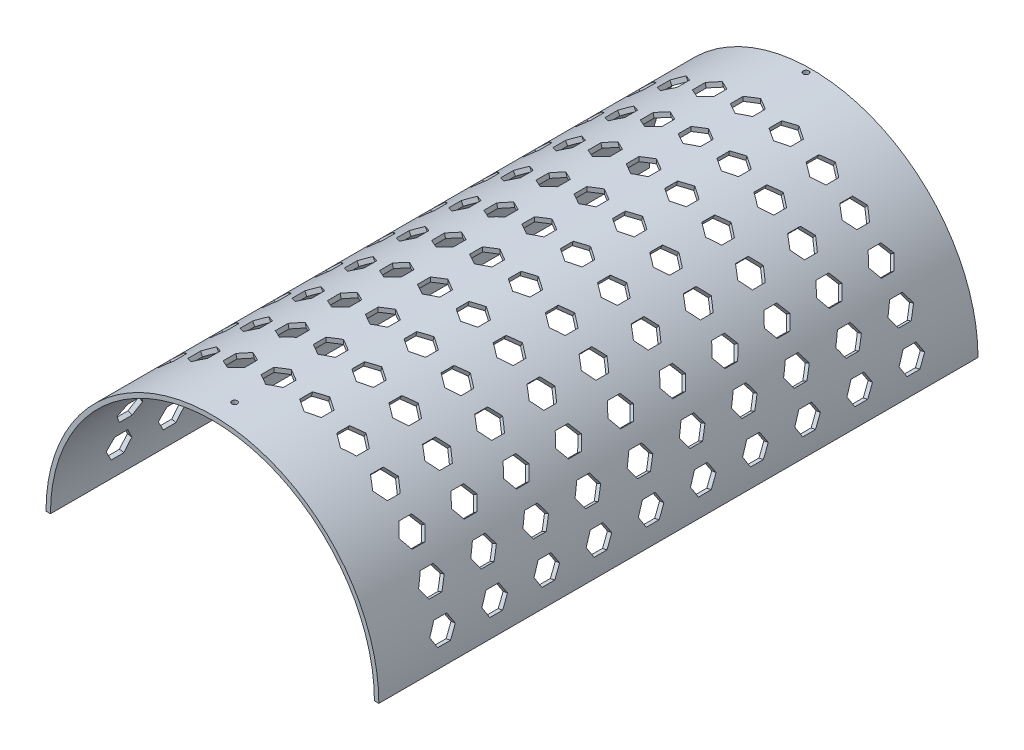
from build123d import *

# Parameters (mm, degrees)
BOSS_EXTRUDE1_DEPTH             = 270
CUT_EXTRUDE2_REACH              = 292.086
CUT_EXTRUDE2_END_RADIUS         = 75
SKETCH4_R                       = 1.25
CUT_EXTRUDE3_REACH              = 292.086
CUT_EXTRUDE3_END_RADIUS         = 75
CIRPATTERN1_COUNT               = 7
CIRPATTERN1_ANGLE               = 80
CIRPATTERN1_THE_OTHER_WAY_COUNT = 7
CIRPATTERN1_THE_OTHER_WAY_ANGLE = 80
LPATTERN1_COUNT                 = 10
LPATTERN1_PITCH                 = 23.5
LPATTERN1_COPY_1_REACH          = 292.086
LPATTERN1_COPY_1_END_RADIUS     = 75
LPATTERN1_COPY_2_REACH          = 292.086
LPATTERN1_COPY_2_END_RADIUS     = 75
LPATTERN1_COPY_3_REACH          = 292.086
LPATTERN1_COPY_3_END_RADIUS     = 75
LPATTERN1_COPY_4_REACH          = 292.086
LPATTERN1_COPY_4_END_RADIUS     = 75
LPATTERN1_COPY_5_REACH          = 292.086
LPATTERN1_COPY_5_END_RADIUS     = 75
LPATTERN1_COPY_6_REACH          = 292.086
LPATTERN1_COPY_6_END_RADIUS     = 75
LPATTERN1_COPY_7_REACH          = 292.086
LPATTERN1_COPY_7_END_RADIUS     = 75
LPATTERN1_COPY_8_REACH          = 292.086
LPATTERN1_COPY_8_END_RADIUS     = 75
LPATTERN1_COPY_9_REACH          = 292.086
LPATTERN1_COPY_9_END_RADIUS     = 75
LPATTERN1_COPY_10_REACH         = 292.086
LPATTERN1_COPY_10_END_RADIUS    = 75
LPATTERN1_COPY_11_REACH         = 292.086
LPATTERN1_COPY_11_END_RADIUS    = 75
LPATTERN1_COPY_12_REACH         = 292.086
LPATTERN1_COPY_12_END_RADIUS    = 75
LPATTERN1_COPY_13_REACH         = 292.086
LPATTERN1_COPY_13_END_RADIUS    = 75
LPATTERN1_COPY_14_REACH         = 292.086
LPATTERN1_COPY_14_END_RADIUS    = 75
LPATTERN1_COPY_15_REACH         = 292.086
LPATTERN1_COPY_15_END_RADIUS    = 75
LPATTERN1_COPY_16_REACH         = 292.086
LPATTERN1_COPY_16_END_RADIUS    = 75
LPATTERN1_COPY_17_REACH         = 292.086
LPATTERN1_COPY_17_END_RADIUS    = 75
LPATTERN1_COPY_18_REACH         = 292.086
LPATTERN1_COPY_18_END_RADIUS    = 75
LPATTERN1_COPY_19_REACH         = 292.086
LPATTERN1_COPY_19_END_RADIUS    = 75
LPATTERN1_COPY_20_REACH         = 292.086
LPATTERN1_COPY_20_END_RADIUS    = 75
LPATTERN1_COPY_21_REACH         = 292.086
LPATTERN1_COPY_21_END_RADIUS    = 75
LPATTERN1_COPY_22_REACH         = 292.086
LPATTERN1_COPY_22_END_RADIUS    = 75
LPATTERN1_COPY_23_REACH         = 292.086
LPATTERN1_COPY_23_END_RADIUS    = 75
LPATTERN1_COPY_24_REACH         = 292.086
LPATTERN1_COPY_24_END_RADIUS    = 75
LPATTERN1_COPY_25_REACH         = 292.086
LPATTERN1_COPY_25_END_RADIUS    = 75
LPATTERN1_COPY_26_REACH         = 292.086
LPATTERN1_COPY_26_END_RADIUS    = 75
LPATTERN1_COPY_27_REACH         = 292.086
LPATTERN1_COPY_27_END_RADIUS    = 75
LPATTERN1_COPY_28_REACH         = 292.086
LPATTERN1_COPY_28_END_RADIUS    = 75
LPATTERN1_COPY_29_REACH         = 292.086
LPATTERN1_COPY_29_END_RADIUS    = 75
LPATTERN1_COPY_30_REACH         = 292.086
LPATTERN1_COPY_30_END_RADIUS    = 75
LPATTERN1_COPY_31_REACH         = 292.086
LPATTERN1_COPY_31_END_RADIUS    = 75
LPATTERN1_COPY_32_REACH         = 292.086
LPATTERN1_COPY_32_END_RADIUS    = 75
LPATTERN1_COPY_33_REACH         = 292.086
LPATTERN1_COPY_33_END_RADIUS    = 75
LPATTERN1_COPY_34_REACH         = 292.086
LPATTERN1_COPY_34_END_RADIUS    = 75
LPATTERN1_COPY_35_REACH         = 292.086
LPATTERN1_COPY_35_END_RADIUS    = 75
LPATTERN1_COPY_36_REACH         = 292.086
LPATTERN1_COPY_36_END_RADIUS    = 75
LPATTERN1_COPY_37_REACH         = 292.086
LPATTERN1_COPY_37_END_RADIUS    = 75
LPATTERN1_COPY_38_REACH         = 292.086
LPATTERN1_COPY_38_END_RADIUS    = 75
LPATTERN1_COPY_39_REACH         = 292.086
LPATTERN1_COPY_39_END_RADIUS    = 75
LPATTERN1_COPY_40_REACH         = 292.086
LPATTERN1_COPY_40_END_RADIUS    = 75
LPATTERN1_COPY_41_REACH         = 292.086
LPATTERN1_COPY_41_END_RADIUS    = 75
LPATTERN1_COPY_42_REACH         = 292.086
LPATTERN1_COPY_42_END_RADIUS    = 75
LPATTERN1_COPY_43_REACH         = 292.086
LPATTERN1_COPY_43_END_RADIUS    = 75
LPATTERN1_COPY_44_REACH         = 292.086
LPATTERN1_COPY_44_END_RADIUS    = 75
LPATTERN1_COPY_45_REACH         = 292.086
LPATTERN1_COPY_45_END_RADIUS    = 75
LPATTERN1_COPY_46_REACH         = 292.086
LPATTERN1_COPY_46_END_RADIUS    = 75
LPATTERN1_COPY_47_REACH         = 292.086
LPATTERN1_COPY_47_END_RADIUS    = 75
LPATTERN1_COPY_48_REACH         = 292.086
LPATTERN1_COPY_48_END_RADIUS    = 75
LPATTERN1_COPY_49_REACH         = 292.086
LPATTERN1_COPY_49_END_RADIUS    = 75
LPATTERN1_COPY_50_REACH         = 292.086
LPATTERN1_COPY_50_END_RADIUS    = 75
LPATTERN1_COPY_51_REACH         = 292.086
LPATTERN1_COPY_51_END_RADIUS    = 75
LPATTERN1_COPY_52_REACH         = 292.086
LPATTERN1_COPY_52_END_RADIUS    = 75
LPATTERN1_COPY_53_REACH         = 292.086
LPATTERN1_COPY_53_END_RADIUS    = 75
LPATTERN1_COPY_54_REACH         = 292.086
LPATTERN1_COPY_54_END_RADIUS    = 75
LPATTERN1_COPY_55_REACH         = 292.086
LPATTERN1_COPY_55_END_RADIUS    = 75
LPATTERN1_COPY_56_REACH         = 292.086
LPATTERN1_COPY_56_END_RADIUS    = 75
LPATTERN1_COPY_57_REACH         = 292.086
LPATTERN1_COPY_57_END_RADIUS    = 75
LPATTERN1_COPY_58_REACH         = 292.086
LPATTERN1_COPY_58_END_RADIUS    = 75
LPATTERN1_COPY_59_REACH         = 292.086
LPATTERN1_COPY_59_END_RADIUS    = 75
LPATTERN1_COPY_60_REACH         = 292.086
LPATTERN1_COPY_60_END_RADIUS    = 75
LPATTERN1_COPY_61_REACH         = 292.086
LPATTERN1_COPY_61_END_RADIUS    = 75
LPATTERN1_COPY_62_REACH         = 292.086
LPATTERN1_COPY_62_END_RADIUS    = 75
LPATTERN1_COPY_63_REACH         = 292.086
LPATTERN1_COPY_63_END_RADIUS    = 75
LPATTERN1_COPY_64_REACH         = 292.086
LPATTERN1_COPY_64_END_RADIUS    = 75
LPATTERN1_COPY_65_REACH         = 292.086
LPATTERN1_COPY_65_END_RADIUS    = 75
LPATTERN1_COPY_66_REACH         = 292.086
LPATTERN1_COPY_66_END_RADIUS    = 75
LPATTERN1_COPY_67_REACH         = 292.086
LPATTERN1_COPY_67_END_RADIUS    = 75
LPATTERN1_COPY_68_REACH         = 292.086
LPATTERN1_COPY_68_END_RADIUS    = 75
LPATTERN1_COPY_69_REACH         = 292.086
LPATTERN1_COPY_69_END_RADIUS    = 75
LPATTERN1_COPY_70_REACH         = 292.086
LPATTERN1_COPY_70_END_RADIUS    = 75
LPATTERN1_COPY_71_REACH         = 292.086
LPATTERN1_COPY_71_END_RADIUS    = 75
LPATTERN1_COPY_72_REACH         = 292.086
LPATTERN1_COPY_72_END_RADIUS    = 75
LPATTERN1_COPY_73_REACH         = 292.086
LPATTERN1_COPY_73_END_RADIUS    = 75
LPATTERN1_COPY_74_REACH         = 292.086
LPATTERN1_COPY_74_END_RADIUS    = 75
LPATTERN1_COPY_75_REACH         = 292.086
LPATTERN1_COPY_75_END_RADIUS    = 75
LPATTERN1_COPY_76_REACH         = 292.086
LPATTERN1_COPY_76_END_RADIUS    = 75
LPATTERN1_COPY_77_REACH         = 292.086
LPATTERN1_COPY_77_END_RADIUS    = 75
LPATTERN1_COPY_78_REACH         = 292.086
LPATTERN1_COPY_78_END_RADIUS    = 75
LPATTERN1_COPY_79_REACH         = 292.086
LPATTERN1_COPY_79_END_RADIUS    = 75
LPATTERN1_COPY_80_REACH         = 292.086
LPATTERN1_COPY_80_END_RADIUS    = 75
LPATTERN1_COPY_81_REACH         = 292.086
LPATTERN1_COPY_81_END_RADIUS    = 75
LPATTERN1_COPY_82_REACH         = 292.086
LPATTERN1_COPY_82_END_RADIUS    = 75
LPATTERN1_COPY_83_REACH         = 292.086
LPATTERN1_COPY_83_END_RADIUS    = 75
LPATTERN1_COPY_84_REACH         = 292.086
LPATTERN1_COPY_84_END_RADIUS    = 75
LPATTERN1_COPY_85_REACH         = 292.086
LPATTERN1_COPY_85_END_RADIUS    = 75
LPATTERN1_COPY_86_REACH         = 292.086
LPATTERN1_COPY_86_END_RADIUS    = 75
LPATTERN1_COPY_87_REACH         = 292.086
LPATTERN1_COPY_87_END_RADIUS    = 75
LPATTERN1_COPY_88_REACH         = 292.086
LPATTERN1_COPY_88_END_RADIUS    = 75
LPATTERN1_COPY_89_REACH         = 292.086
LPATTERN1_COPY_89_END_RADIUS    = 75
LPATTERN1_COPY_90_REACH         = 292.086
LPATTERN1_COPY_90_END_RADIUS    = 75
LPATTERN1_COPY_91_REACH         = 292.086
LPATTERN1_COPY_91_END_RADIUS    = 75
LPATTERN1_COPY_92_REACH         = 292.086
LPATTERN1_COPY_92_END_RADIUS    = 75
LPATTERN1_COPY_93_REACH         = 292.086
LPATTERN1_COPY_93_END_RADIUS    = 75
LPATTERN1_COPY_94_REACH         = 292.086
LPATTERN1_COPY_94_END_RADIUS    = 75
LPATTERN1_COPY_95_REACH         = 292.086
LPATTERN1_COPY_95_END_RADIUS    = 75
LPATTERN1_COPY_96_REACH         = 292.086
LPATTERN1_COPY_96_END_RADIUS    = 75
LPATTERN1_COPY_97_REACH         = 292.086
LPATTERN1_COPY_97_END_RADIUS    = 75
LPATTERN1_COPY_98_REACH         = 292.086
LPATTERN1_COPY_98_END_RADIUS    = 75
LPATTERN1_COPY_99_REACH         = 292.086
LPATTERN1_COPY_99_END_RADIUS    = 75
LPATTERN1_COPY_100_REACH        = 292.086
LPATTERN1_COPY_100_END_RADIUS   = 75
LPATTERN1_COPY_101_REACH        = 292.086
LPATTERN1_COPY_101_END_RADIUS   = 75
LPATTERN1_COPY_102_REACH        = 292.086
LPATTERN1_COPY_102_END_RADIUS   = 75
LPATTERN1_COPY_103_REACH        = 292.086
LPATTERN1_COPY_103_END_RADIUS   = 75
LPATTERN1_COPY_104_REACH        = 292.086
LPATTERN1_COPY_104_END_RADIUS   = 75
LPATTERN1_COPY_105_REACH        = 292.086
LPATTERN1_COPY_105_END_RADIUS   = 75
LPATTERN1_COPY_106_REACH        = 292.086
LPATTERN1_COPY_106_END_RADIUS   = 75
LPATTERN1_COPY_107_REACH        = 292.086
LPATTERN1_COPY_107_END_RADIUS   = 75
LPATTERN1_COPY_108_REACH        = 292.086
LPATTERN1_COPY_108_END_RADIUS   = 75


with BuildPart() as part:
    # Sketch1 → Boss-Extrude1 (new body)
    with BuildSketch(Plane.XY):
        with BuildLine():
            Line((-75, 0), (-73, 0))
            ThreePointArc((-73, 0), (0, 73), (73, 0))
            Line((73, 0), (75, 0))
            ThreePointArc((75, 0), (0, 75), (-75, 0))
        make_face()
    extrude(amount=BOSS_EXTRUDE1_DEPTH)

    # Cut-Extrude2: up to this cylinder (the profile starts inside it)
    cut_extrude2_end = Plane(origin=(0, 0, 131.25), z_dir=(0, 0, -1)) * Cylinder(CUT_EXTRUDE2_END_RADIUS, 992.672, mode=Mode.PRIVATE)
    # Sketch4 → Cut-Extrude2 (cut, up to the surface)
    with BuildSketch(Plane(origin=(0, 0, 0), x_dir=(1, 0, 0), z_dir=(0, 1, 0)), mode=Mode.PRIVATE) as cut_extrude2_sk1:
        with Locations((0, -2.5)):
            Circle(SKETCH4_R)
    cut_extrude2_tool1 = extrude(cut_extrude2_sk1.sketch, amount=CUT_EXTRUDE2_REACH, mode=Mode.PRIVATE) & cut_extrude2_end
    add(cut_extrude2_tool1.solids().sort_by_distance((0, 0, 2.5))[0], mode=Mode.SUBTRACT)
    # Sketch4 → Cut-Extrude2 (cut, up to the surface)
    with BuildSketch(Plane(origin=(0, 0, 0), x_dir=(1, 0, 0), z_dir=(0, 1, 0)), mode=Mode.PRIVATE) as cut_extrude2_sk2:
        with Locations((0, -260)):
            Circle(SKETCH4_R)
    cut_extrude2_tool2 = extrude(cut_extrude2_sk2.sketch, amount=CUT_EXTRUDE2_REACH, mode=Mode.PRIVATE) & cut_extrude2_end
    add(cut_extrude2_tool2.solids().sort_by_distance((0, 0, 260))[0], mode=Mode.SUBTRACT)

    # Cut-Extrude3: up to this cylinder (the profile starts inside it)
    cut_extrude3_end = Plane(origin=(0, 0, 28.692656), z_dir=(0, 0, -1)) * Cylinder(CUT_EXTRUDE3_END_RADIUS, 735.172, mode=Mode.PRIVATE)
    # Sketch2 → Cut-Extrude3 (cut, up to the surface)
    with BuildSketch(Plane(origin=(0, 0, 0), x_dir=(1, 0, 0), z_dir=(0, 1, 0)), mode=Mode.PRIVATE) as cut_extrude3_sk1:
        Polygon((5, -31.579407127), (5, -25.805904435), (0, -22.919153089), (-5, -25.805904435), (-5, -31.579407127), (0, -34.466158473), align=None)
    cut_extrude3_tool1 = extrude(cut_extrude3_sk1.sketch, amount=CUT_EXTRUDE3_REACH, mode=Mode.PRIVATE) & cut_extrude3_end
    cut_extrude3 = cut_extrude3_tool1.solids().sort_by_distance((0, 0, 28.692656))[0]
    add(cut_extrude3, mode=Mode.SUBTRACT)

    # CirPattern1: Cut-Extrude3 ×7 about axis
    cirpattern1_axis = Axis((0, 0, 270), (0, 0, 1))
    for i in range(1, CIRPATTERN1_COUNT):
        add(cut_extrude3.rotate(cirpattern1_axis, i * CIRPATTERN1_ANGLE / (CIRPATTERN1_COUNT - 1)), mode=Mode.SUBTRACT)

    # CirPattern1 the other way: Cut-Extrude3 ×7 about axis
    cirpattern1_the_other_way_axis = Axis((0, 0, 270), (0, 0, -1))
    for i in range(1, CIRPATTERN1_THE_OTHER_WAY_COUNT):
        add(cut_extrude3.rotate(cirpattern1_the_other_way_axis, i * CIRPATTERN1_THE_OTHER_WAY_ANGLE / (CIRPATTERN1_THE_OTHER_WAY_COUNT - 1)), mode=Mode.SUBTRACT)

    # LPattern1: Cut-Extrude3 ×10
    with Locations(*[(0, 0, i * LPATTERN1_PITCH) for i in range(1, LPATTERN1_COUNT)]):
        add(cut_extrude3, mode=Mode.SUBTRACT)

    # LPattern1 copy 1: up to this cylinder (the profile starts inside it)
    lpattern1_copy_1_end = Plane(origin=(0, 0, 28.692656), z_dir=(0, 0, -1)) * Cylinder(LPATTERN1_COPY_1_END_RADIUS, 735.172, mode=Mode.PRIVATE)
    # LPattern1 copy 1 sketch → LPattern1 copy 1 (cut, up to the surface)
    with BuildSketch(Plane(origin=(0, 0, 23.5), x_dir=(0.9730448705798237, 0.23061587074244067, 0), z_dir=(-0.23061587074244067, 0.9730448705798237, 0)), mode=Mode.PRIVATE) as lpattern1_copy_1_sk1:
        Polygon((5, -31.579407127), (5, -25.805904435), (0, -22.919153089), (-5, -25.805904435), (-5, -31.579407127), (0, -34.466158473), align=None)
    lpattern1_copy_1_tool1 = extrude(lpattern1_copy_1_sk1.sketch, amount=LPATTERN1_COPY_1_REACH, mode=Mode.PRIVATE) & lpattern1_copy_1_end
    add(lpattern1_copy_1_tool1.solids().sort_by_distance((0, 0, 28.692656))[0], mode=Mode.SUBTRACT)

    # LPattern1 copy 2: up to this cylinder (the profile starts inside it)
    lpattern1_copy_2_end = Plane(origin=(0, 0, 28.692656), z_dir=(0, 0, -1)) * Cylinder(LPATTERN1_COPY_2_END_RADIUS, 735.172, mode=Mode.PRIVATE)
    # LPattern1 copy 2 sketch → LPattern1 copy 2 (cut, up to the surface)
    with BuildSketch(Plane(origin=(0, 0, 47), x_dir=(0.9730448705798237, 0.23061587074244067, 0), z_dir=(-0.23061587074244067, 0.9730448705798237, 0)), mode=Mode.PRIVATE) as lpattern1_copy_2_sk1:
        Polygon((5, -31.579407127), (5, -25.805904435), (0, -22.919153089), (-5, -25.805904435), (-5, -31.579407127), (0, -34.466158473), align=None)
    lpattern1_copy_2_tool1 = extrude(lpattern1_copy_2_sk1.sketch, amount=LPATTERN1_COPY_2_REACH, mode=Mode.PRIVATE) & lpattern1_copy_2_end
    add(lpattern1_copy_2_tool1.solids().sort_by_distance((0, 0, 28.692656))[0], mode=Mode.SUBTRACT)

    # LPattern1 copy 3: up to this cylinder (the profile starts inside it)
    lpattern1_copy_3_end = Plane(origin=(0, 0, 28.692656), z_dir=(0, 0, -1)) * Cylinder(LPATTERN1_COPY_3_END_RADIUS, 735.172, mode=Mode.PRIVATE)
    # LPattern1 copy 3 sketch → LPattern1 copy 3 (cut, up to the surface)
    with BuildSketch(Plane(origin=(0, 0, 70.5), x_dir=(0.9730448705798237, 0.23061587074244067, 0), z_dir=(-0.23061587074244067, 0.9730448705798237, 0)), mode=Mode.PRIVATE) as lpattern1_copy_3_sk1:
        Polygon((5, -31.579407127), (5, -25.805904435), (0, -22.919153089), (-5, -25.805904435), (-5, -31.579407127), (0, -34.466158473), align=None)
    lpattern1_copy_3_tool1 = extrude(lpattern1_copy_3_sk1.sketch, amount=LPATTERN1_COPY_3_REACH, mode=Mode.PRIVATE) & lpattern1_copy_3_end
    add(lpattern1_copy_3_tool1.solids().sort_by_distance((0, 0, 28.692656))[0], mode=Mode.SUBTRACT)

    # LPattern1 copy 4: up to this cylinder (the profile starts inside it)
    lpattern1_copy_4_end = Plane(origin=(0, 0, 28.692656), z_dir=(0, 0, -1)) * Cylinder(LPATTERN1_COPY_4_END_RADIUS, 735.172, mode=Mode.PRIVATE)
    # LPattern1 copy 4 sketch → LPattern1 copy 4 (cut, up to the surface)
    with BuildSketch(Plane(origin=(0, 0, 94), x_dir=(0.9730448705798237, 0.23061587074244067, 0), z_dir=(-0.23061587074244067, 0.9730448705798237, 0)), mode=Mode.PRIVATE) as lpattern1_copy_4_sk1:
        Polygon((5, -31.579407127), (5, -25.805904435), (0, -22.919153089), (-5, -25.805904435), (-5, -31.579407127), (0, -34.466158473), align=None)
    lpattern1_copy_4_tool1 = extrude(lpattern1_copy_4_sk1.sketch, amount=LPATTERN1_COPY_4_REACH, mode=Mode.PRIVATE) & lpattern1_copy_4_end
    add(lpattern1_copy_4_tool1.solids().sort_by_distance((0, 0, 28.692656))[0], mode=Mode.SUBTRACT)

    # LPattern1 copy 5: up to this cylinder (the profile starts inside it)
    lpattern1_copy_5_end = Plane(origin=(0, 0, 28.692656), z_dir=(0, 0, -1)) * Cylinder(LPATTERN1_COPY_5_END_RADIUS, 735.172, mode=Mode.PRIVATE)
    # LPattern1 copy 5 sketch → LPattern1 copy 5 (cut, up to the surface)
    with BuildSketch(Plane(origin=(0, 0, 117.5), x_dir=(0.9730448705798237, 0.23061587074244067, 0), z_dir=(-0.23061587074244067, 0.9730448705798237, 0)), mode=Mode.PRIVATE) as lpattern1_copy_5_sk1:
        Polygon((5, -31.579407127), (5, -25.805904435), (0, -22.919153089), (-5, -25.805904435), (-5, -31.579407127), (0, -34.466158473), align=None)
    lpattern1_copy_5_tool1 = extrude(lpattern1_copy_5_sk1.sketch, amount=LPATTERN1_COPY_5_REACH, mode=Mode.PRIVATE) & lpattern1_copy_5_end
    add(lpattern1_copy_5_tool1.solids().sort_by_distance((0, 0, 28.692656))[0], mode=Mode.SUBTRACT)

    # LPattern1 copy 6: up to this cylinder (the profile starts inside it)
    lpattern1_copy_6_end = Plane(origin=(0, 0, 28.692656), z_dir=(0, 0, -1)) * Cylinder(LPATTERN1_COPY_6_END_RADIUS, 735.172, mode=Mode.PRIVATE)
    # LPattern1 copy 6 sketch → LPattern1 copy 6 (cut, up to the surface)
    with BuildSketch(Plane(origin=(0, 0, 141), x_dir=(0.9730448705798237, 0.23061587074244067, 0), z_dir=(-0.23061587074244067, 0.9730448705798237, 0)), mode=Mode.PRIVATE) as lpattern1_copy_6_sk1:
        Polygon((5, -31.579407127), (5, -25.805904435), (0, -22.919153089), (-5, -25.805904435), (-5, -31.579407127), (0, -34.466158473), align=None)
    lpattern1_copy_6_tool1 = extrude(lpattern1_copy_6_sk1.sketch, amount=LPATTERN1_COPY_6_REACH, mode=Mode.PRIVATE) & lpattern1_copy_6_end
    add(lpattern1_copy_6_tool1.solids().sort_by_distance((0, 0, 28.692656))[0], mode=Mode.SUBTRACT)

    # LPattern1 copy 7: up to this cylinder (the profile starts inside it)
    lpattern1_copy_7_end = Plane(origin=(0, 0, 28.692656), z_dir=(0, 0, -1)) * Cylinder(LPATTERN1_COPY_7_END_RADIUS, 735.172, mode=Mode.PRIVATE)
    # LPattern1 copy 7 sketch → LPattern1 copy 7 (cut, up to the surface)
    with BuildSketch(Plane(origin=(0, 0, 164.5), x_dir=(0.9730448705798237, 0.23061587074244067, 0), z_dir=(-0.23061587074244067, 0.9730448705798237, 0)), mode=Mode.PRIVATE) as lpattern1_copy_7_sk1:
        Polygon((5, -31.579407127), (5, -25.805904435), (0, -22.919153089), (-5, -25.805904435), (-5, -31.579407127), (0, -34.466158473), align=None)
    lpattern1_copy_7_tool1 = extrude(lpattern1_copy_7_sk1.sketch, amount=LPATTERN1_COPY_7_REACH, mode=Mode.PRIVATE) & lpattern1_copy_7_end
    add(lpattern1_copy_7_tool1.solids().sort_by_distance((0, 0, 28.692656))[0], mode=Mode.SUBTRACT)

    # LPattern1 copy 8: up to this cylinder (the profile starts inside it)
    lpattern1_copy_8_end = Plane(origin=(0, 0, 28.692656), z_dir=(0, 0, -1)) * Cylinder(LPATTERN1_COPY_8_END_RADIUS, 735.172, mode=Mode.PRIVATE)
    # LPattern1 copy 8 sketch → LPattern1 copy 8 (cut, up to the surface)
    with BuildSketch(Plane(origin=(0, 0, 188), x_dir=(0.9730448705798237, 0.23061587074244067, 0), z_dir=(-0.23061587074244067, 0.9730448705798237, 0)), mode=Mode.PRIVATE) as lpattern1_copy_8_sk1:
        Polygon((5, -31.579407127), (5, -25.805904435), (0, -22.919153089), (-5, -25.805904435), (-5, -31.579407127), (0, -34.466158473), align=None)
    lpattern1_copy_8_tool1 = extrude(lpattern1_copy_8_sk1.sketch, amount=LPATTERN1_COPY_8_REACH, mode=Mode.PRIVATE) & lpattern1_copy_8_end
    add(lpattern1_copy_8_tool1.solids().sort_by_distance((0, 0, 28.692656))[0], mode=Mode.SUBTRACT)

    # LPattern1 copy 9: up to this cylinder (the profile starts inside it)
    lpattern1_copy_9_end = Plane(origin=(0, 0, 28.692656), z_dir=(0, 0, -1)) * Cylinder(LPATTERN1_COPY_9_END_RADIUS, 735.172, mode=Mode.PRIVATE)
    # LPattern1 copy 9 sketch → LPattern1 copy 9 (cut, up to the surface)
    with BuildSketch(Plane(origin=(0, 0, 211.5), x_dir=(0.9730448705798237, 0.23061587074244067, 0), z_dir=(-0.23061587074244067, 0.9730448705798237, 0)), mode=Mode.PRIVATE) as lpattern1_copy_9_sk1:
        Polygon((5, -31.579407127), (5, -25.805904435), (0, -22.919153089), (-5, -25.805904435), (-5, -31.579407127), (0, -34.466158473), align=None)
    lpattern1_copy_9_tool1 = extrude(lpattern1_copy_9_sk1.sketch, amount=LPATTERN1_COPY_9_REACH, mode=Mode.PRIVATE) & lpattern1_copy_9_end
    add(lpattern1_copy_9_tool1.solids().sort_by_distance((0, 0, 28.692656))[0], mode=Mode.SUBTRACT)

    # LPattern1 copy 10: up to this cylinder (the profile starts inside it)
    lpattern1_copy_10_end = Plane(origin=(0, 0, 28.692656), z_dir=(0, 0, -1)) * Cylinder(LPATTERN1_COPY_10_END_RADIUS, 735.172, mode=Mode.PRIVATE)
    # LPattern1 copy 10 sketch → LPattern1 copy 10 (cut, up to the surface)
    with BuildSketch(Plane(origin=(0, 0, 23.5), x_dir=(0.8936326403234118, 0.44879918020046305, 0), z_dir=(-0.44879918020046305, 0.8936326403234118, 0)), mode=Mode.PRIVATE) as lpattern1_copy_10_sk1:
        Polygon((5, -31.579407127), (5, -25.805904435), (0, -22.919153089), (-5, -25.805904435), (-5, -31.579407127), (0, -34.466158473), align=None)
    lpattern1_copy_10_tool1 = extrude(lpattern1_copy_10_sk1.sketch, amount=LPATTERN1_COPY_10_REACH, mode=Mode.PRIVATE) & lpattern1_copy_10_end
    add(lpattern1_copy_10_tool1.solids().sort_by_distance((0, 0, 28.692656))[0], mode=Mode.SUBTRACT)

    # LPattern1 copy 11: up to this cylinder (the profile starts inside it)
    lpattern1_copy_11_end = Plane(origin=(0, 0, 28.692656), z_dir=(0, 0, -1)) * Cylinder(LPATTERN1_COPY_11_END_RADIUS, 735.172, mode=Mode.PRIVATE)
    # LPattern1 copy 11 sketch → LPattern1 copy 11 (cut, up to the surface)
    with BuildSketch(Plane(origin=(0, 0, 47), x_dir=(0.8936326403234118, 0.44879918020046305, 0), z_dir=(-0.44879918020046305, 0.8936326403234118, 0)), mode=Mode.PRIVATE) as lpattern1_copy_11_sk1:
        Polygon((5, -31.579407127), (5, -25.805904435), (0, -22.919153089), (-5, -25.805904435), (-5, -31.579407127), (0, -34.466158473), align=None)
    lpattern1_copy_11_tool1 = extrude(lpattern1_copy_11_sk1.sketch, amount=LPATTERN1_COPY_11_REACH, mode=Mode.PRIVATE) & lpattern1_copy_11_end
    add(lpattern1_copy_11_tool1.solids().sort_by_distance((0, 0, 28.692656))[0], mode=Mode.SUBTRACT)

    # LPattern1 copy 12: up to this cylinder (the profile starts inside it)
    lpattern1_copy_12_end = Plane(origin=(0, 0, 28.692656), z_dir=(0, 0, -1)) * Cylinder(LPATTERN1_COPY_12_END_RADIUS, 735.172, mode=Mode.PRIVATE)
    # LPattern1 copy 12 sketch → LPattern1 copy 12 (cut, up to the surface)
    with BuildSketch(Plane(origin=(0, 0, 70.5), x_dir=(0.8936326403234118, 0.44879918020046305, 0), z_dir=(-0.44879918020046305, 0.8936326403234118, 0)), mode=Mode.PRIVATE) as lpattern1_copy_12_sk1:
        Polygon((5, -31.579407127), (5, -25.805904435), (0, -22.919153089), (-5, -25.805904435), (-5, -31.579407127), (0, -34.466158473), align=None)
    lpattern1_copy_12_tool1 = extrude(lpattern1_copy_12_sk1.sketch, amount=LPATTERN1_COPY_12_REACH, mode=Mode.PRIVATE) & lpattern1_copy_12_end
    add(lpattern1_copy_12_tool1.solids().sort_by_distance((0, 0, 28.692656))[0], mode=Mode.SUBTRACT)

    # LPattern1 copy 13: up to this cylinder (the profile starts inside it)
    lpattern1_copy_13_end = Plane(origin=(0, 0, 28.692656), z_dir=(0, 0, -1)) * Cylinder(LPATTERN1_COPY_13_END_RADIUS, 735.172, mode=Mode.PRIVATE)
    # LPattern1 copy 13 sketch → LPattern1 copy 13 (cut, up to the surface)
    with BuildSketch(Plane(origin=(0, 0, 94), x_dir=(0.8936326403234118, 0.44879918020046305, 0), z_dir=(-0.44879918020046305, 0.8936326403234118, 0)), mode=Mode.PRIVATE) as lpattern1_copy_13_sk1:
        Polygon((5, -31.579407127), (5, -25.805904435), (0, -22.919153089), (-5, -25.805904435), (-5, -31.579407127), (0, -34.466158473), align=None)
    lpattern1_copy_13_tool1 = extrude(lpattern1_copy_13_sk1.sketch, amount=LPATTERN1_COPY_13_REACH, mode=Mode.PRIVATE) & lpattern1_copy_13_end
    add(lpattern1_copy_13_tool1.solids().sort_by_distance((0, 0, 28.692656))[0], mode=Mode.SUBTRACT)

    # LPattern1 copy 14: up to this cylinder (the profile starts inside it)
    lpattern1_copy_14_end = Plane(origin=(0, 0, 28.692656), z_dir=(0, 0, -1)) * Cylinder(LPATTERN1_COPY_14_END_RADIUS, 735.172, mode=Mode.PRIVATE)
    # LPattern1 copy 14 sketch → LPattern1 copy 14 (cut, up to the surface)
    with BuildSketch(Plane(origin=(0, 0, 117.5), x_dir=(0.8936326403234118, 0.44879918020046305, 0), z_dir=(-0.44879918020046305, 0.8936326403234118, 0)), mode=Mode.PRIVATE) as lpattern1_copy_14_sk1:
        Polygon((5, -31.579407127), (5, -25.805904435), (0, -22.919153089), (-5, -25.805904435), (-5, -31.579407127), (0, -34.466158473), align=None)
    lpattern1_copy_14_tool1 = extrude(lpattern1_copy_14_sk1.sketch, amount=LPATTERN1_COPY_14_REACH, mode=Mode.PRIVATE) & lpattern1_copy_14_end
    add(lpattern1_copy_14_tool1.solids().sort_by_distance((0, 0, 28.692656))[0], mode=Mode.SUBTRACT)

    # LPattern1 copy 15: up to this cylinder (the profile starts inside it)
    lpattern1_copy_15_end = Plane(origin=(0, 0, 28.692656), z_dir=(0, 0, -1)) * Cylinder(LPATTERN1_COPY_15_END_RADIUS, 735.172, mode=Mode.PRIVATE)
    # LPattern1 copy 15 sketch → LPattern1 copy 15 (cut, up to the surface)
    with BuildSketch(Plane(origin=(0, 0, 141), x_dir=(0.8936326403234118, 0.44879918020046305, 0), z_dir=(-0.44879918020046305, 0.8936326403234118, 0)), mode=Mode.PRIVATE) as lpattern1_copy_15_sk1:
        Polygon((5, -31.579407127), (5, -25.805904435), (0, -22.919153089), (-5, -25.805904435), (-5, -31.579407127), (0, -34.466158473), align=None)
    lpattern1_copy_15_tool1 = extrude(lpattern1_copy_15_sk1.sketch, amount=LPATTERN1_COPY_15_REACH, mode=Mode.PRIVATE) & lpattern1_copy_15_end
    add(lpattern1_copy_15_tool1.solids().sort_by_distance((0, 0, 28.692656))[0], mode=Mode.SUBTRACT)

    # LPattern1 copy 16: up to this cylinder (the profile starts inside it)
    lpattern1_copy_16_end = Plane(origin=(0, 0, 28.692656), z_dir=(0, 0, -1)) * Cylinder(LPATTERN1_COPY_16_END_RADIUS, 735.172, mode=Mode.PRIVATE)
    # LPattern1 copy 16 sketch → LPattern1 copy 16 (cut, up to the surface)
    with BuildSketch(Plane(origin=(0, 0, 164.5), x_dir=(0.8936326403234118, 0.44879918020046305, 0), z_dir=(-0.44879918020046305, 0.8936326403234118, 0)), mode=Mode.PRIVATE) as lpattern1_copy_16_sk1:
        Polygon((5, -31.579407127), (5, -25.805904435), (0, -22.919153089), (-5, -25.805904435), (-5, -31.579407127), (0, -34.466158473), align=None)
    lpattern1_copy_16_tool1 = extrude(lpattern1_copy_16_sk1.sketch, amount=LPATTERN1_COPY_16_REACH, mode=Mode.PRIVATE) & lpattern1_copy_16_end
    add(lpattern1_copy_16_tool1.solids().sort_by_distance((0, 0, 28.692656))[0], mode=Mode.SUBTRACT)

    # LPattern1 copy 17: up to this cylinder (the profile starts inside it)
    lpattern1_copy_17_end = Plane(origin=(0, 0, 28.692656), z_dir=(0, 0, -1)) * Cylinder(LPATTERN1_COPY_17_END_RADIUS, 735.172, mode=Mode.PRIVATE)
    # LPattern1 copy 17 sketch → LPattern1 copy 17 (cut, up to the surface)
    with BuildSketch(Plane(origin=(0, 0, 188), x_dir=(0.8936326403234118, 0.44879918020046305, 0), z_dir=(-0.44879918020046305, 0.8936326403234118, 0)), mode=Mode.PRIVATE) as lpattern1_copy_17_sk1:
        Polygon((5, -31.579407127), (5, -25.805904435), (0, -22.919153089), (-5, -25.805904435), (-5, -31.579407127), (0, -34.466158473), align=None)
    lpattern1_copy_17_tool1 = extrude(lpattern1_copy_17_sk1.sketch, amount=LPATTERN1_COPY_17_REACH, mode=Mode.PRIVATE) & lpattern1_copy_17_end
    add(lpattern1_copy_17_tool1.solids().sort_by_distance((0, 0, 28.692656))[0], mode=Mode.SUBTRACT)

    # LPattern1 copy 18: up to this cylinder (the profile starts inside it)
    lpattern1_copy_18_end = Plane(origin=(0, 0, 28.692656), z_dir=(0, 0, -1)) * Cylinder(LPATTERN1_COPY_18_END_RADIUS, 735.172, mode=Mode.PRIVATE)
    # LPattern1 copy 18 sketch → LPattern1 copy 18 (cut, up to the surface)
    with BuildSketch(Plane(origin=(0, 0, 211.5), x_dir=(0.8936326403234118, 0.44879918020046305, 0), z_dir=(-0.44879918020046305, 0.8936326403234118, 0)), mode=Mode.PRIVATE) as lpattern1_copy_18_sk1:
        Polygon((5, -31.579407127), (5, -25.805904435), (0, -22.919153089), (-5, -25.805904435), (-5, -31.579407127), (0, -34.466158473), align=None)
    lpattern1_copy_18_tool1 = extrude(lpattern1_copy_18_sk1.sketch, amount=LPATTERN1_COPY_18_REACH, mode=Mode.PRIVATE) & lpattern1_copy_18_end
    add(lpattern1_copy_18_tool1.solids().sort_by_distance((0, 0, 28.692656))[0], mode=Mode.SUBTRACT)

    # LPattern1 copy 19: up to this cylinder (the profile starts inside it)
    lpattern1_copy_19_end = Plane(origin=(0, 0, 28.692656), z_dir=(0, 0, -1)) * Cylinder(LPATTERN1_COPY_19_END_RADIUS, 735.172, mode=Mode.PRIVATE)
    # LPattern1 copy 19 sketch → LPattern1 copy 19 (cut, up to the surface)
    with BuildSketch(Plane(origin=(0, 0, 23.5), x_dir=(0.766044443118977, 0.6427876096865405, 0), z_dir=(-0.6427876096865405, 0.766044443118977, 0)), mode=Mode.PRIVATE) as lpattern1_copy_19_sk1:
        Polygon((5, -31.579407127), (5, -25.805904435), (0, -22.919153089), (-5, -25.805904435), (-5, -31.579407127), (0, -34.466158473), align=None)
    lpattern1_copy_19_tool1 = extrude(lpattern1_copy_19_sk1.sketch, amount=LPATTERN1_COPY_19_REACH, mode=Mode.PRIVATE) & lpattern1_copy_19_end
    add(lpattern1_copy_19_tool1.solids().sort_by_distance((0, 0, 28.692656))[0], mode=Mode.SUBTRACT)

    # LPattern1 copy 20: up to this cylinder (the profile starts inside it)
    lpattern1_copy_20_end = Plane(origin=(0, 0, 28.692656), z_dir=(0, 0, -1)) * Cylinder(LPATTERN1_COPY_20_END_RADIUS, 735.172, mode=Mode.PRIVATE)
    # LPattern1 copy 20 sketch → LPattern1 copy 20 (cut, up to the surface)
    with BuildSketch(Plane(origin=(0, 0, 47), x_dir=(0.766044443118977, 0.6427876096865405, 0), z_dir=(-0.6427876096865405, 0.766044443118977, 0)), mode=Mode.PRIVATE) as lpattern1_copy_20_sk1:
        Polygon((5, -31.579407127), (5, -25.805904435), (0, -22.919153089), (-5, -25.805904435), (-5, -31.579407127), (0, -34.466158473), align=None)
    lpattern1_copy_20_tool1 = extrude(lpattern1_copy_20_sk1.sketch, amount=LPATTERN1_COPY_20_REACH, mode=Mode.PRIVATE) & lpattern1_copy_20_end
    add(lpattern1_copy_20_tool1.solids().sort_by_distance((0, 0, 28.692656))[0], mode=Mode.SUBTRACT)

    # LPattern1 copy 21: up to this cylinder (the profile starts inside it)
    lpattern1_copy_21_end = Plane(origin=(0, 0, 28.692656), z_dir=(0, 0, -1)) * Cylinder(LPATTERN1_COPY_21_END_RADIUS, 735.172, mode=Mode.PRIVATE)
    # LPattern1 copy 21 sketch → LPattern1 copy 21 (cut, up to the surface)
    with BuildSketch(Plane(origin=(0, 0, 70.5), x_dir=(0.766044443118977, 0.6427876096865405, 0), z_dir=(-0.6427876096865405, 0.766044443118977, 0)), mode=Mode.PRIVATE) as lpattern1_copy_21_sk1:
        Polygon((5, -31.579407127), (5, -25.805904435), (0, -22.919153089), (-5, -25.805904435), (-5, -31.579407127), (0, -34.466158473), align=None)
    lpattern1_copy_21_tool1 = extrude(lpattern1_copy_21_sk1.sketch, amount=LPATTERN1_COPY_21_REACH, mode=Mode.PRIVATE) & lpattern1_copy_21_end
    add(lpattern1_copy_21_tool1.solids().sort_by_distance((0, 0, 28.692656))[0], mode=Mode.SUBTRACT)

    # LPattern1 copy 22: up to this cylinder (the profile starts inside it)
    lpattern1_copy_22_end = Plane(origin=(0, 0, 28.692656), z_dir=(0, 0, -1)) * Cylinder(LPATTERN1_COPY_22_END_RADIUS, 735.172, mode=Mode.PRIVATE)
    # LPattern1 copy 22 sketch → LPattern1 copy 22 (cut, up to the surface)
    with BuildSketch(Plane(origin=(0, 0, 94), x_dir=(0.766044443118977, 0.6427876096865405, 0), z_dir=(-0.6427876096865405, 0.766044443118977, 0)), mode=Mode.PRIVATE) as lpattern1_copy_22_sk1:
        Polygon((5, -31.579407127), (5, -25.805904435), (0, -22.919153089), (-5, -25.805904435), (-5, -31.579407127), (0, -34.466158473), align=None)
    lpattern1_copy_22_tool1 = extrude(lpattern1_copy_22_sk1.sketch, amount=LPATTERN1_COPY_22_REACH, mode=Mode.PRIVATE) & lpattern1_copy_22_end
    add(lpattern1_copy_22_tool1.solids().sort_by_distance((0, 0, 28.692656))[0], mode=Mode.SUBTRACT)

    # LPattern1 copy 23: up to this cylinder (the profile starts inside it)
    lpattern1_copy_23_end = Plane(origin=(0, 0, 28.692656), z_dir=(0, 0, -1)) * Cylinder(LPATTERN1_COPY_23_END_RADIUS, 735.172, mode=Mode.PRIVATE)
    # LPattern1 copy 23 sketch → LPattern1 copy 23 (cut, up to the surface)
    with BuildSketch(Plane(origin=(0, 0, 117.5), x_dir=(0.766044443118977, 0.6427876096865405, 0), z_dir=(-0.6427876096865405, 0.766044443118977, 0)), mode=Mode.PRIVATE) as lpattern1_copy_23_sk1:
        Polygon((5, -31.579407127), (5, -25.805904435), (0, -22.919153089), (-5, -25.805904435), (-5, -31.579407127), (0, -34.466158473), align=None)
    lpattern1_copy_23_tool1 = extrude(lpattern1_copy_23_sk1.sketch, amount=LPATTERN1_COPY_23_REACH, mode=Mode.PRIVATE) & lpattern1_copy_23_end
    add(lpattern1_copy_23_tool1.solids().sort_by_distance((0, 0, 28.692656))[0], mode=Mode.SUBTRACT)

    # LPattern1 copy 24: up to this cylinder (the profile starts inside it)
    lpattern1_copy_24_end = Plane(origin=(0, 0, 28.692656), z_dir=(0, 0, -1)) * Cylinder(LPATTERN1_COPY_24_END_RADIUS, 735.172, mode=Mode.PRIVATE)
    # LPattern1 copy 24 sketch → LPattern1 copy 24 (cut, up to the surface)
    with BuildSketch(Plane(origin=(0, 0, 141), x_dir=(0.766044443118977, 0.6427876096865405, 0), z_dir=(-0.6427876096865405, 0.766044443118977, 0)), mode=Mode.PRIVATE) as lpattern1_copy_24_sk1:
        Polygon((5, -31.579407127), (5, -25.805904435), (0, -22.919153089), (-5, -25.805904435), (-5, -31.579407127), (0, -34.466158473), align=None)
    lpattern1_copy_24_tool1 = extrude(lpattern1_copy_24_sk1.sketch, amount=LPATTERN1_COPY_24_REACH, mode=Mode.PRIVATE) & lpattern1_copy_24_end
    add(lpattern1_copy_24_tool1.solids().sort_by_distance((0, 0, 28.692656))[0], mode=Mode.SUBTRACT)

    # LPattern1 copy 25: up to this cylinder (the profile starts inside it)
    lpattern1_copy_25_end = Plane(origin=(0, 0, 28.692656), z_dir=(0, 0, -1)) * Cylinder(LPATTERN1_COPY_25_END_RADIUS, 735.172, mode=Mode.PRIVATE)
    # LPattern1 copy 25 sketch → LPattern1 copy 25 (cut, up to the surface)
    with BuildSketch(Plane(origin=(0, 0, 164.5), x_dir=(0.766044443118977, 0.6427876096865405, 0), z_dir=(-0.6427876096865405, 0.766044443118977, 0)), mode=Mode.PRIVATE) as lpattern1_copy_25_sk1:
        Polygon((5, -31.579407127), (5, -25.805904435), (0, -22.919153089), (-5, -25.805904435), (-5, -31.579407127), (0, -34.466158473), align=None)
    lpattern1_copy_25_tool1 = extrude(lpattern1_copy_25_sk1.sketch, amount=LPATTERN1_COPY_25_REACH, mode=Mode.PRIVATE) & lpattern1_copy_25_end
    add(lpattern1_copy_25_tool1.solids().sort_by_distance((0, 0, 28.692656))[0], mode=Mode.SUBTRACT)

    # LPattern1 copy 26: up to this cylinder (the profile starts inside it)
    lpattern1_copy_26_end = Plane(origin=(0, 0, 28.692656), z_dir=(0, 0, -1)) * Cylinder(LPATTERN1_COPY_26_END_RADIUS, 735.172, mode=Mode.PRIVATE)
    # LPattern1 copy 26 sketch → LPattern1 copy 26 (cut, up to the surface)
    with BuildSketch(Plane(origin=(0, 0, 188), x_dir=(0.766044443118977, 0.6427876096865405, 0), z_dir=(-0.6427876096865405, 0.766044443118977, 0)), mode=Mode.PRIVATE) as lpattern1_copy_26_sk1:
        Polygon((5, -31.579407127), (5, -25.805904435), (0, -22.919153089), (-5, -25.805904435), (-5, -31.579407127), (0, -34.466158473), align=None)
    lpattern1_copy_26_tool1 = extrude(lpattern1_copy_26_sk1.sketch, amount=LPATTERN1_COPY_26_REACH, mode=Mode.PRIVATE) & lpattern1_copy_26_end
    add(lpattern1_copy_26_tool1.solids().sort_by_distance((0, 0, 28.692656))[0], mode=Mode.SUBTRACT)

    # LPattern1 copy 27: up to this cylinder (the profile starts inside it)
    lpattern1_copy_27_end = Plane(origin=(0, 0, 28.692656), z_dir=(0, 0, -1)) * Cylinder(LPATTERN1_COPY_27_END_RADIUS, 735.172, mode=Mode.PRIVATE)
    # LPattern1 copy 27 sketch → LPattern1 copy 27 (cut, up to the surface)
    with BuildSketch(Plane(origin=(0, 0, 211.5), x_dir=(0.766044443118977, 0.6427876096865405, 0), z_dir=(-0.6427876096865405, 0.766044443118977, 0)), mode=Mode.PRIVATE) as lpattern1_copy_27_sk1:
        Polygon((5, -31.579407127), (5, -25.805904435), (0, -22.919153089), (-5, -25.805904435), (-5, -31.579407127), (0, -34.466158473), align=None)
    lpattern1_copy_27_tool1 = extrude(lpattern1_copy_27_sk1.sketch, amount=LPATTERN1_COPY_27_REACH, mode=Mode.PRIVATE) & lpattern1_copy_27_end
    add(lpattern1_copy_27_tool1.solids().sort_by_distance((0, 0, 28.692656))[0], mode=Mode.SUBTRACT)

    # LPattern1 copy 28: up to this cylinder (the profile starts inside it)
    lpattern1_copy_28_end = Plane(origin=(0, 0, 28.692656), z_dir=(0, 0, -1)) * Cylinder(LPATTERN1_COPY_28_END_RADIUS, 735.172, mode=Mode.PRIVATE)
    # LPattern1 copy 28 sketch → LPattern1 copy 28 (cut, up to the surface)
    with BuildSketch(Plane(origin=(0, 0, 23.5), x_dir=(0.5971585917027846, 0.802123192755045, 0), z_dir=(-0.802123192755045, 0.5971585917027846, 0)), mode=Mode.PRIVATE) as lpattern1_copy_28_sk1:
        Polygon((5, -31.579407127), (5, -25.805904435), (0, -22.919153089), (-5, -25.805904435), (-5, -31.579407127), (0, -34.466158473), align=None)
    lpattern1_copy_28_tool1 = extrude(lpattern1_copy_28_sk1.sketch, amount=LPATTERN1_COPY_28_REACH, mode=Mode.PRIVATE) & lpattern1_copy_28_end
    add(lpattern1_copy_28_tool1.solids().sort_by_distance((0, 0, 28.692656))[0], mode=Mode.SUBTRACT)

    # LPattern1 copy 29: up to this cylinder (the profile starts inside it)
    lpattern1_copy_29_end = Plane(origin=(0, 0, 28.692656), z_dir=(0, 0, -1)) * Cylinder(LPATTERN1_COPY_29_END_RADIUS, 735.172, mode=Mode.PRIVATE)
    # LPattern1 copy 29 sketch → LPattern1 copy 29 (cut, up to the surface)
    with BuildSketch(Plane(origin=(0, 0, 47), x_dir=(0.5971585917027846, 0.802123192755045, 0), z_dir=(-0.802123192755045, 0.5971585917027846, 0)), mode=Mode.PRIVATE) as lpattern1_copy_29_sk1:
        Polygon((5, -31.579407127), (5, -25.805904435), (0, -22.919153089), (-5, -25.805904435), (-5, -31.579407127), (0, -34.466158473), align=None)
    lpattern1_copy_29_tool1 = extrude(lpattern1_copy_29_sk1.sketch, amount=LPATTERN1_COPY_29_REACH, mode=Mode.PRIVATE) & lpattern1_copy_29_end
    add(lpattern1_copy_29_tool1.solids().sort_by_distance((0, 0, 28.692656))[0], mode=Mode.SUBTRACT)

    # LPattern1 copy 30: up to this cylinder (the profile starts inside it)
    lpattern1_copy_30_end = Plane(origin=(0, 0, 28.692656), z_dir=(0, 0, -1)) * Cylinder(LPATTERN1_COPY_30_END_RADIUS, 735.172, mode=Mode.PRIVATE)
    # LPattern1 copy 30 sketch → LPattern1 copy 30 (cut, up to the surface)
    with BuildSketch(Plane(origin=(0, 0, 70.5), x_dir=(0.5971585917027846, 0.802123192755045, 0), z_dir=(-0.802123192755045, 0.5971585917027846, 0)), mode=Mode.PRIVATE) as lpattern1_copy_30_sk1:
        Polygon((5, -31.579407127), (5, -25.805904435), (0, -22.919153089), (-5, -25.805904435), (-5, -31.579407127), (0, -34.466158473), align=None)
    lpattern1_copy_30_tool1 = extrude(lpattern1_copy_30_sk1.sketch, amount=LPATTERN1_COPY_30_REACH, mode=Mode.PRIVATE) & lpattern1_copy_30_end
    add(lpattern1_copy_30_tool1.solids().sort_by_distance((0, 0, 28.692656))[0], mode=Mode.SUBTRACT)

    # LPattern1 copy 31: up to this cylinder (the profile starts inside it)
    lpattern1_copy_31_end = Plane(origin=(0, 0, 28.692656), z_dir=(0, 0, -1)) * Cylinder(LPATTERN1_COPY_31_END_RADIUS, 735.172, mode=Mode.PRIVATE)
    # LPattern1 copy 31 sketch → LPattern1 copy 31 (cut, up to the surface)
    with BuildSketch(Plane(origin=(0, 0, 94), x_dir=(0.5971585917027846, 0.802123192755045, 0), z_dir=(-0.802123192755045, 0.5971585917027846, 0)), mode=Mode.PRIVATE) as lpattern1_copy_31_sk1:
        Polygon((5, -31.579407127), (5, -25.805904435), (0, -22.919153089), (-5, -25.805904435), (-5, -31.579407127), (0, -34.466158473), align=None)
    lpattern1_copy_31_tool1 = extrude(lpattern1_copy_31_sk1.sketch, amount=LPATTERN1_COPY_31_REACH, mode=Mode.PRIVATE) & lpattern1_copy_31_end
    add(lpattern1_copy_31_tool1.solids().sort_by_distance((0, 0, 28.692656))[0], mode=Mode.SUBTRACT)

    # LPattern1 copy 32: up to this cylinder (the profile starts inside it)
    lpattern1_copy_32_end = Plane(origin=(0, 0, 28.692656), z_dir=(0, 0, -1)) * Cylinder(LPATTERN1_COPY_32_END_RADIUS, 735.172, mode=Mode.PRIVATE)
    # LPattern1 copy 32 sketch → LPattern1 copy 32 (cut, up to the surface)
    with BuildSketch(Plane(origin=(0, 0, 117.5), x_dir=(0.5971585917027846, 0.802123192755045, 0), z_dir=(-0.802123192755045, 0.5971585917027846, 0)), mode=Mode.PRIVATE) as lpattern1_copy_32_sk1:
        Polygon((5, -31.579407127), (5, -25.805904435), (0, -22.919153089), (-5, -25.805904435), (-5, -31.579407127), (0, -34.466158473), align=None)
    lpattern1_copy_32_tool1 = extrude(lpattern1_copy_32_sk1.sketch, amount=LPATTERN1_COPY_32_REACH, mode=Mode.PRIVATE) & lpattern1_copy_32_end
    add(lpattern1_copy_32_tool1.solids().sort_by_distance((0, 0, 28.692656))[0], mode=Mode.SUBTRACT)

    # LPattern1 copy 33: up to this cylinder (the profile starts inside it)
    lpattern1_copy_33_end = Plane(origin=(0, 0, 28.692656), z_dir=(0, 0, -1)) * Cylinder(LPATTERN1_COPY_33_END_RADIUS, 735.172, mode=Mode.PRIVATE)
    # LPattern1 copy 33 sketch → LPattern1 copy 33 (cut, up to the surface)
    with BuildSketch(Plane(origin=(0, 0, 141), x_dir=(0.5971585917027846, 0.802123192755045, 0), z_dir=(-0.802123192755045, 0.5971585917027846, 0)), mode=Mode.PRIVATE) as lpattern1_copy_33_sk1:
        Polygon((5, -31.579407127), (5, -25.805904435), (0, -22.919153089), (-5, -25.805904435), (-5, -31.579407127), (0, -34.466158473), align=None)
    lpattern1_copy_33_tool1 = extrude(lpattern1_copy_33_sk1.sketch, amount=LPATTERN1_COPY_33_REACH, mode=Mode.PRIVATE) & lpattern1_copy_33_end
    add(lpattern1_copy_33_tool1.solids().sort_by_distance((0, 0, 28.692656))[0], mode=Mode.SUBTRACT)

    # LPattern1 copy 34: up to this cylinder (the profile starts inside it)
    lpattern1_copy_34_end = Plane(origin=(0, 0, 28.692656), z_dir=(0, 0, -1)) * Cylinder(LPATTERN1_COPY_34_END_RADIUS, 735.172, mode=Mode.PRIVATE)
    # LPattern1 copy 34 sketch → LPattern1 copy 34 (cut, up to the surface)
    with BuildSketch(Plane(origin=(0, 0, 164.5), x_dir=(0.5971585917027846, 0.802123192755045, 0), z_dir=(-0.802123192755045, 0.5971585917027846, 0)), mode=Mode.PRIVATE) as lpattern1_copy_34_sk1:
        Polygon((5, -31.579407127), (5, -25.805904435), (0, -22.919153089), (-5, -25.805904435), (-5, -31.579407127), (0, -34.466158473), align=None)
    lpattern1_copy_34_tool1 = extrude(lpattern1_copy_34_sk1.sketch, amount=LPATTERN1_COPY_34_REACH, mode=Mode.PRIVATE) & lpattern1_copy_34_end
    add(lpattern1_copy_34_tool1.solids().sort_by_distance((0, 0, 28.692656))[0], mode=Mode.SUBTRACT)

    # LPattern1 copy 35: up to this cylinder (the profile starts inside it)
    lpattern1_copy_35_end = Plane(origin=(0, 0, 28.692656), z_dir=(0, 0, -1)) * Cylinder(LPATTERN1_COPY_35_END_RADIUS, 735.172, mode=Mode.PRIVATE)
    # LPattern1 copy 35 sketch → LPattern1 copy 35 (cut, up to the surface)
    with BuildSketch(Plane(origin=(0, 0, 188), x_dir=(0.5971585917027846, 0.802123192755045, 0), z_dir=(-0.802123192755045, 0.5971585917027846, 0)), mode=Mode.PRIVATE) as lpattern1_copy_35_sk1:
        Polygon((5, -31.579407127), (5, -25.805904435), (0, -22.919153089), (-5, -25.805904435), (-5, -31.579407127), (0, -34.466158473), align=None)
    lpattern1_copy_35_tool1 = extrude(lpattern1_copy_35_sk1.sketch, amount=LPATTERN1_COPY_35_REACH, mode=Mode.PRIVATE) & lpattern1_copy_35_end
    add(lpattern1_copy_35_tool1.solids().sort_by_distance((0, 0, 28.692656))[0], mode=Mode.SUBTRACT)

    # LPattern1 copy 36: up to this cylinder (the profile starts inside it)
    lpattern1_copy_36_end = Plane(origin=(0, 0, 28.692656), z_dir=(0, 0, -1)) * Cylinder(LPATTERN1_COPY_36_END_RADIUS, 735.172, mode=Mode.PRIVATE)
    # LPattern1 copy 36 sketch → LPattern1 copy 36 (cut, up to the surface)
    with BuildSketch(Plane(origin=(0, 0, 211.5), x_dir=(0.5971585917027846, 0.802123192755045, 0), z_dir=(-0.802123192755045, 0.5971585917027846, 0)), mode=Mode.PRIVATE) as lpattern1_copy_36_sk1:
        Polygon((5, -31.579407127), (5, -25.805904435), (0, -22.919153089), (-5, -25.805904435), (-5, -31.579407127), (0, -34.466158473), align=None)
    lpattern1_copy_36_tool1 = extrude(lpattern1_copy_36_sk1.sketch, amount=LPATTERN1_COPY_36_REACH, mode=Mode.PRIVATE) & lpattern1_copy_36_end
    add(lpattern1_copy_36_tool1.solids().sort_by_distance((0, 0, 28.692656))[0], mode=Mode.SUBTRACT)

    # LPattern1 copy 37: up to this cylinder (the profile starts inside it)
    lpattern1_copy_37_end = Plane(origin=(0, 0, 28.692656), z_dir=(0, 0, -1)) * Cylinder(LPATTERN1_COPY_37_END_RADIUS, 735.172, mode=Mode.PRIVATE)
    # LPattern1 copy 37 sketch → LPattern1 copy 37 (cut, up to the surface)
    with BuildSketch(Plane(origin=(0, 0, 23.5), x_dir=(0.39607976603915446, 0.918216106880275, 0), z_dir=(-0.918216106880275, 0.39607976603915446, 0)), mode=Mode.PRIVATE) as lpattern1_copy_37_sk1:
        Polygon((5, -31.579407127), (5, -25.805904435), (0, -22.919153089), (-5, -25.805904435), (-5, -31.579407127), (0, -34.466158473), align=None)
    lpattern1_copy_37_tool1 = extrude(lpattern1_copy_37_sk1.sketch, amount=LPATTERN1_COPY_37_REACH, mode=Mode.PRIVATE) & lpattern1_copy_37_end
    add(lpattern1_copy_37_tool1.solids().sort_by_distance((0, 0, 28.692656))[0], mode=Mode.SUBTRACT)

    # LPattern1 copy 38: up to this cylinder (the profile starts inside it)
    lpattern1_copy_38_end = Plane(origin=(0, 0, 28.692656), z_dir=(0, 0, -1)) * Cylinder(LPATTERN1_COPY_38_END_RADIUS, 735.172, mode=Mode.PRIVATE)
    # LPattern1 copy 38 sketch → LPattern1 copy 38 (cut, up to the surface)
    with BuildSketch(Plane(origin=(0, 0, 47), x_dir=(0.39607976603915446, 0.918216106880275, 0), z_dir=(-0.918216106880275, 0.39607976603915446, 0)), mode=Mode.PRIVATE) as lpattern1_copy_38_sk1:
        Polygon((5, -31.579407127), (5, -25.805904435), (0, -22.919153089), (-5, -25.805904435), (-5, -31.579407127), (0, -34.466158473), align=None)
    lpattern1_copy_38_tool1 = extrude(lpattern1_copy_38_sk1.sketch, amount=LPATTERN1_COPY_38_REACH, mode=Mode.PRIVATE) & lpattern1_copy_38_end
    add(lpattern1_copy_38_tool1.solids().sort_by_distance((0, 0, 28.692656))[0], mode=Mode.SUBTRACT)

    # LPattern1 copy 39: up to this cylinder (the profile starts inside it)
    lpattern1_copy_39_end = Plane(origin=(0, 0, 28.692656), z_dir=(0, 0, -1)) * Cylinder(LPATTERN1_COPY_39_END_RADIUS, 735.172, mode=Mode.PRIVATE)
    # LPattern1 copy 39 sketch → LPattern1 copy 39 (cut, up to the surface)
    with BuildSketch(Plane(origin=(0, 0, 70.5), x_dir=(0.39607976603915446, 0.918216106880275, 0), z_dir=(-0.918216106880275, 0.39607976603915446, 0)), mode=Mode.PRIVATE) as lpattern1_copy_39_sk1:
        Polygon((5, -31.579407127), (5, -25.805904435), (0, -22.919153089), (-5, -25.805904435), (-5, -31.579407127), (0, -34.466158473), align=None)
    lpattern1_copy_39_tool1 = extrude(lpattern1_copy_39_sk1.sketch, amount=LPATTERN1_COPY_39_REACH, mode=Mode.PRIVATE) & lpattern1_copy_39_end
    add(lpattern1_copy_39_tool1.solids().sort_by_distance((0, 0, 28.692656))[0], mode=Mode.SUBTRACT)

    # LPattern1 copy 40: up to this cylinder (the profile starts inside it)
    lpattern1_copy_40_end = Plane(origin=(0, 0, 28.692656), z_dir=(0, 0, -1)) * Cylinder(LPATTERN1_COPY_40_END_RADIUS, 735.172, mode=Mode.PRIVATE)
    # LPattern1 copy 40 sketch → LPattern1 copy 40 (cut, up to the surface)
    with BuildSketch(Plane(origin=(0, 0, 94), x_dir=(0.39607976603915446, 0.918216106880275, 0), z_dir=(-0.918216106880275, 0.39607976603915446, 0)), mode=Mode.PRIVATE) as lpattern1_copy_40_sk1:
        Polygon((5, -31.579407127), (5, -25.805904435), (0, -22.919153089), (-5, -25.805904435), (-5, -31.579407127), (0, -34.466158473), align=None)
    lpattern1_copy_40_tool1 = extrude(lpattern1_copy_40_sk1.sketch, amount=LPATTERN1_COPY_40_REACH, mode=Mode.PRIVATE) & lpattern1_copy_40_end
    add(lpattern1_copy_40_tool1.solids().sort_by_distance((0, 0, 28.692656))[0], mode=Mode.SUBTRACT)

    # LPattern1 copy 41: up to this cylinder (the profile starts inside it)
    lpattern1_copy_41_end = Plane(origin=(0, 0, 28.692656), z_dir=(0, 0, -1)) * Cylinder(LPATTERN1_COPY_41_END_RADIUS, 735.172, mode=Mode.PRIVATE)
    # LPattern1 copy 41 sketch → LPattern1 copy 41 (cut, up to the surface)
    with BuildSketch(Plane(origin=(0, 0, 117.5), x_dir=(0.39607976603915446, 0.918216106880275, 0), z_dir=(-0.918216106880275, 0.39607976603915446, 0)), mode=Mode.PRIVATE) as lpattern1_copy_41_sk1:
        Polygon((5, -31.579407127), (5, -25.805904435), (0, -22.919153089), (-5, -25.805904435), (-5, -31.579407127), (0, -34.466158473), align=None)
    lpattern1_copy_41_tool1 = extrude(lpattern1_copy_41_sk1.sketch, amount=LPATTERN1_COPY_41_REACH, mode=Mode.PRIVATE) & lpattern1_copy_41_end
    add(lpattern1_copy_41_tool1.solids().sort_by_distance((0, 0, 28.692656))[0], mode=Mode.SUBTRACT)

    # LPattern1 copy 42: up to this cylinder (the profile starts inside it)
    lpattern1_copy_42_end = Plane(origin=(0, 0, 28.692656), z_dir=(0, 0, -1)) * Cylinder(LPATTERN1_COPY_42_END_RADIUS, 735.172, mode=Mode.PRIVATE)
    # LPattern1 copy 42 sketch → LPattern1 copy 42 (cut, up to the surface)
    with BuildSketch(Plane(origin=(0, 0, 141), x_dir=(0.39607976603915446, 0.918216106880275, 0), z_dir=(-0.918216106880275, 0.39607976603915446, 0)), mode=Mode.PRIVATE) as lpattern1_copy_42_sk1:
        Polygon((5, -31.579407127), (5, -25.805904435), (0, -22.919153089), (-5, -25.805904435), (-5, -31.579407127), (0, -34.466158473), align=None)
    lpattern1_copy_42_tool1 = extrude(lpattern1_copy_42_sk1.sketch, amount=LPATTERN1_COPY_42_REACH, mode=Mode.PRIVATE) & lpattern1_copy_42_end
    add(lpattern1_copy_42_tool1.solids().sort_by_distance((0, 0, 28.692656))[0], mode=Mode.SUBTRACT)

    # LPattern1 copy 43: up to this cylinder (the profile starts inside it)
    lpattern1_copy_43_end = Plane(origin=(0, 0, 28.692656), z_dir=(0, 0, -1)) * Cylinder(LPATTERN1_COPY_43_END_RADIUS, 735.172, mode=Mode.PRIVATE)
    # LPattern1 copy 43 sketch → LPattern1 copy 43 (cut, up to the surface)
    with BuildSketch(Plane(origin=(0, 0, 164.5), x_dir=(0.39607976603915446, 0.918216106880275, 0), z_dir=(-0.918216106880275, 0.39607976603915446, 0)), mode=Mode.PRIVATE) as lpattern1_copy_43_sk1:
        Polygon((5, -31.579407127), (5, -25.805904435), (0, -22.919153089), (-5, -25.805904435), (-5, -31.579407127), (0, -34.466158473), align=None)
    lpattern1_copy_43_tool1 = extrude(lpattern1_copy_43_sk1.sketch, amount=LPATTERN1_COPY_43_REACH, mode=Mode.PRIVATE) & lpattern1_copy_43_end
    add(lpattern1_copy_43_tool1.solids().sort_by_distance((0, 0, 28.692656))[0], mode=Mode.SUBTRACT)

    # LPattern1 copy 44: up to this cylinder (the profile starts inside it)
    lpattern1_copy_44_end = Plane(origin=(0, 0, 28.692656), z_dir=(0, 0, -1)) * Cylinder(LPATTERN1_COPY_44_END_RADIUS, 735.172, mode=Mode.PRIVATE)
    # LPattern1 copy 44 sketch → LPattern1 copy 44 (cut, up to the surface)
    with BuildSketch(Plane(origin=(0, 0, 188), x_dir=(0.39607976603915446, 0.918216106880275, 0), z_dir=(-0.918216106880275, 0.39607976603915446, 0)), mode=Mode.PRIVATE) as lpattern1_copy_44_sk1:
        Polygon((5, -31.579407127), (5, -25.805904435), (0, -22.919153089), (-5, -25.805904435), (-5, -31.579407127), (0, -34.466158473), align=None)
    lpattern1_copy_44_tool1 = extrude(lpattern1_copy_44_sk1.sketch, amount=LPATTERN1_COPY_44_REACH, mode=Mode.PRIVATE) & lpattern1_copy_44_end
    add(lpattern1_copy_44_tool1.solids().sort_by_distance((0, 0, 28.692656))[0], mode=Mode.SUBTRACT)

    # LPattern1 copy 45: up to this cylinder (the profile starts inside it)
    lpattern1_copy_45_end = Plane(origin=(0, 0, 28.692656), z_dir=(0, 0, -1)) * Cylinder(LPATTERN1_COPY_45_END_RADIUS, 735.172, mode=Mode.PRIVATE)
    # LPattern1 copy 45 sketch → LPattern1 copy 45 (cut, up to the surface)
    with BuildSketch(Plane(origin=(0, 0, 211.5), x_dir=(0.39607976603915446, 0.918216106880275, 0), z_dir=(-0.918216106880275, 0.39607976603915446, 0)), mode=Mode.PRIVATE) as lpattern1_copy_45_sk1:
        Polygon((5, -31.579407127), (5, -25.805904435), (0, -22.919153089), (-5, -25.805904435), (-5, -31.579407127), (0, -34.466158473), align=None)
    lpattern1_copy_45_tool1 = extrude(lpattern1_copy_45_sk1.sketch, amount=LPATTERN1_COPY_45_REACH, mode=Mode.PRIVATE) & lpattern1_copy_45_end
    add(lpattern1_copy_45_tool1.solids().sort_by_distance((0, 0, 28.692656))[0], mode=Mode.SUBTRACT)

    # LPattern1 copy 46: up to this cylinder (the profile starts inside it)
    lpattern1_copy_46_end = Plane(origin=(0, 0, 28.692656), z_dir=(0, 0, -1)) * Cylinder(LPATTERN1_COPY_46_END_RADIUS, 735.172, mode=Mode.PRIVATE)
    # LPattern1 copy 46 sketch → LPattern1 copy 46 (cut, up to the surface)
    with BuildSketch(Plane(origin=(0, 0, 23.5), x_dir=(0.17364817766692736, 0.9848077530122086, 0), z_dir=(-0.9848077530122086, 0.17364817766692736, 0)), mode=Mode.PRIVATE) as lpattern1_copy_46_sk1:
        Polygon((5, -31.579407127), (5, -25.805904435), (0, -22.919153089), (-5, -25.805904435), (-5, -31.579407127), (0, -34.466158473), align=None)
    lpattern1_copy_46_tool1 = extrude(lpattern1_copy_46_sk1.sketch, amount=LPATTERN1_COPY_46_REACH, mode=Mode.PRIVATE) & lpattern1_copy_46_end
    add(lpattern1_copy_46_tool1.solids().sort_by_distance((0, 0, 28.692656))[0], mode=Mode.SUBTRACT)

    # LPattern1 copy 47: up to this cylinder (the profile starts inside it)
    lpattern1_copy_47_end = Plane(origin=(0, 0, 28.692656), z_dir=(0, 0, -1)) * Cylinder(LPATTERN1_COPY_47_END_RADIUS, 735.172, mode=Mode.PRIVATE)
    # LPattern1 copy 47 sketch → LPattern1 copy 47 (cut, up to the surface)
    with BuildSketch(Plane(origin=(0, 0, 47), x_dir=(0.17364817766692736, 0.9848077530122086, 0), z_dir=(-0.9848077530122086, 0.17364817766692736, 0)), mode=Mode.PRIVATE) as lpattern1_copy_47_sk1:
        Polygon((5, -31.579407127), (5, -25.805904435), (0, -22.919153089), (-5, -25.805904435), (-5, -31.579407127), (0, -34.466158473), align=None)
    lpattern1_copy_47_tool1 = extrude(lpattern1_copy_47_sk1.sketch, amount=LPATTERN1_COPY_47_REACH, mode=Mode.PRIVATE) & lpattern1_copy_47_end
    add(lpattern1_copy_47_tool1.solids().sort_by_distance((0, 0, 28.692656))[0], mode=Mode.SUBTRACT)

    # LPattern1 copy 48: up to this cylinder (the profile starts inside it)
    lpattern1_copy_48_end = Plane(origin=(0, 0, 28.692656), z_dir=(0, 0, -1)) * Cylinder(LPATTERN1_COPY_48_END_RADIUS, 735.172, mode=Mode.PRIVATE)
    # LPattern1 copy 48 sketch → LPattern1 copy 48 (cut, up to the surface)
    with BuildSketch(Plane(origin=(0, 0, 70.5), x_dir=(0.17364817766692736, 0.9848077530122086, 0), z_dir=(-0.9848077530122086, 0.17364817766692736, 0)), mode=Mode.PRIVATE) as lpattern1_copy_48_sk1:
        Polygon((5, -31.579407127), (5, -25.805904435), (0, -22.919153089), (-5, -25.805904435), (-5, -31.579407127), (0, -34.466158473), align=None)
    lpattern1_copy_48_tool1 = extrude(lpattern1_copy_48_sk1.sketch, amount=LPATTERN1_COPY_48_REACH, mode=Mode.PRIVATE) & lpattern1_copy_48_end
    add(lpattern1_copy_48_tool1.solids().sort_by_distance((0, 0, 28.692656))[0], mode=Mode.SUBTRACT)

    # LPattern1 copy 49: up to this cylinder (the profile starts inside it)
    lpattern1_copy_49_end = Plane(origin=(0, 0, 28.692656), z_dir=(0, 0, -1)) * Cylinder(LPATTERN1_COPY_49_END_RADIUS, 735.172, mode=Mode.PRIVATE)
    # LPattern1 copy 49 sketch → LPattern1 copy 49 (cut, up to the surface)
    with BuildSketch(Plane(origin=(0, 0, 94), x_dir=(0.17364817766692736, 0.9848077530122086, 0), z_dir=(-0.9848077530122086, 0.17364817766692736, 0)), mode=Mode.PRIVATE) as lpattern1_copy_49_sk1:
        Polygon((5, -31.579407127), (5, -25.805904435), (0, -22.919153089), (-5, -25.805904435), (-5, -31.579407127), (0, -34.466158473), align=None)
    lpattern1_copy_49_tool1 = extrude(lpattern1_copy_49_sk1.sketch, amount=LPATTERN1_COPY_49_REACH, mode=Mode.PRIVATE) & lpattern1_copy_49_end
    add(lpattern1_copy_49_tool1.solids().sort_by_distance((0, 0, 28.692656))[0], mode=Mode.SUBTRACT)

    # LPattern1 copy 50: up to this cylinder (the profile starts inside it)
    lpattern1_copy_50_end = Plane(origin=(0, 0, 28.692656), z_dir=(0, 0, -1)) * Cylinder(LPATTERN1_COPY_50_END_RADIUS, 735.172, mode=Mode.PRIVATE)
    # LPattern1 copy 50 sketch → LPattern1 copy 50 (cut, up to the surface)
    with BuildSketch(Plane(origin=(0, 0, 117.5), x_dir=(0.17364817766692736, 0.9848077530122086, 0), z_dir=(-0.9848077530122086, 0.17364817766692736, 0)), mode=Mode.PRIVATE) as lpattern1_copy_50_sk1:
        Polygon((5, -31.579407127), (5, -25.805904435), (0, -22.919153089), (-5, -25.805904435), (-5, -31.579407127), (0, -34.466158473), align=None)
    lpattern1_copy_50_tool1 = extrude(lpattern1_copy_50_sk1.sketch, amount=LPATTERN1_COPY_50_REACH, mode=Mode.PRIVATE) & lpattern1_copy_50_end
    add(lpattern1_copy_50_tool1.solids().sort_by_distance((0, 0, 28.692656))[0], mode=Mode.SUBTRACT)

    # LPattern1 copy 51: up to this cylinder (the profile starts inside it)
    lpattern1_copy_51_end = Plane(origin=(0, 0, 28.692656), z_dir=(0, 0, -1)) * Cylinder(LPATTERN1_COPY_51_END_RADIUS, 735.172, mode=Mode.PRIVATE)
    # LPattern1 copy 51 sketch → LPattern1 copy 51 (cut, up to the surface)
    with BuildSketch(Plane(origin=(0, 0, 141), x_dir=(0.17364817766692736, 0.9848077530122086, 0), z_dir=(-0.9848077530122086, 0.17364817766692736, 0)), mode=Mode.PRIVATE) as lpattern1_copy_51_sk1:
        Polygon((5, -31.579407127), (5, -25.805904435), (0, -22.919153089), (-5, -25.805904435), (-5, -31.579407127), (0, -34.466158473), align=None)
    lpattern1_copy_51_tool1 = extrude(lpattern1_copy_51_sk1.sketch, amount=LPATTERN1_COPY_51_REACH, mode=Mode.PRIVATE) & lpattern1_copy_51_end
    add(lpattern1_copy_51_tool1.solids().sort_by_distance((0, 0, 28.692656))[0], mode=Mode.SUBTRACT)

    # LPattern1 copy 52: up to this cylinder (the profile starts inside it)
    lpattern1_copy_52_end = Plane(origin=(0, 0, 28.692656), z_dir=(0, 0, -1)) * Cylinder(LPATTERN1_COPY_52_END_RADIUS, 735.172, mode=Mode.PRIVATE)
    # LPattern1 copy 52 sketch → LPattern1 copy 52 (cut, up to the surface)
    with BuildSketch(Plane(origin=(0, 0, 164.5), x_dir=(0.17364817766692736, 0.9848077530122086, 0), z_dir=(-0.9848077530122086, 0.17364817766692736, 0)), mode=Mode.PRIVATE) as lpattern1_copy_52_sk1:
        Polygon((5, -31.579407127), (5, -25.805904435), (0, -22.919153089), (-5, -25.805904435), (-5, -31.579407127), (0, -34.466158473), align=None)
    lpattern1_copy_52_tool1 = extrude(lpattern1_copy_52_sk1.sketch, amount=LPATTERN1_COPY_52_REACH, mode=Mode.PRIVATE) & lpattern1_copy_52_end
    add(lpattern1_copy_52_tool1.solids().sort_by_distance((0, 0, 28.692656))[0], mode=Mode.SUBTRACT)

    # LPattern1 copy 53: up to this cylinder (the profile starts inside it)
    lpattern1_copy_53_end = Plane(origin=(0, 0, 28.692656), z_dir=(0, 0, -1)) * Cylinder(LPATTERN1_COPY_53_END_RADIUS, 735.172, mode=Mode.PRIVATE)
    # LPattern1 copy 53 sketch → LPattern1 copy 53 (cut, up to the surface)
    with BuildSketch(Plane(origin=(0, 0, 188), x_dir=(0.17364817766692736, 0.9848077530122086, 0), z_dir=(-0.9848077530122086, 0.17364817766692736, 0)), mode=Mode.PRIVATE) as lpattern1_copy_53_sk1:
        Polygon((5, -31.579407127), (5, -25.805904435), (0, -22.919153089), (-5, -25.805904435), (-5, -31.579407127), (0, -34.466158473), align=None)
    lpattern1_copy_53_tool1 = extrude(lpattern1_copy_53_sk1.sketch, amount=LPATTERN1_COPY_53_REACH, mode=Mode.PRIVATE) & lpattern1_copy_53_end
    add(lpattern1_copy_53_tool1.solids().sort_by_distance((0, 0, 28.692656))[0], mode=Mode.SUBTRACT)

    # LPattern1 copy 54: up to this cylinder (the profile starts inside it)
    lpattern1_copy_54_end = Plane(origin=(0, 0, 28.692656), z_dir=(0, 0, -1)) * Cylinder(LPATTERN1_COPY_54_END_RADIUS, 735.172, mode=Mode.PRIVATE)
    # LPattern1 copy 54 sketch → LPattern1 copy 54 (cut, up to the surface)
    with BuildSketch(Plane(origin=(0, 0, 211.5), x_dir=(0.17364817766692736, 0.9848077530122086, 0), z_dir=(-0.9848077530122086, 0.17364817766692736, 0)), mode=Mode.PRIVATE) as lpattern1_copy_54_sk1:
        Polygon((5, -31.579407127), (5, -25.805904435), (0, -22.919153089), (-5, -25.805904435), (-5, -31.579407127), (0, -34.466158473), align=None)
    lpattern1_copy_54_tool1 = extrude(lpattern1_copy_54_sk1.sketch, amount=LPATTERN1_COPY_54_REACH, mode=Mode.PRIVATE) & lpattern1_copy_54_end
    add(lpattern1_copy_54_tool1.solids().sort_by_distance((0, 0, 28.692656))[0], mode=Mode.SUBTRACT)

    # LPattern1 copy 55: up to this cylinder (the profile starts inside it)
    lpattern1_copy_55_end = Plane(origin=(0, 0, 28.692656), z_dir=(0, 0, -1)) * Cylinder(LPATTERN1_COPY_55_END_RADIUS, 735.172, mode=Mode.PRIVATE)
    # LPattern1 copy 55 sketch → LPattern1 copy 55 (cut, up to the surface)
    with BuildSketch(Plane(origin=(0, 0, 23.5), x_dir=(0.9730448705798237, -0.23061587074244067, 0), z_dir=(0.23061587074244067, 0.9730448705798237, 0)), mode=Mode.PRIVATE) as lpattern1_copy_55_sk1:
        Polygon((5, -31.579407127), (5, -25.805904435), (0, -22.919153089), (-5, -25.805904435), (-5, -31.579407127), (0, -34.466158473), align=None)
    lpattern1_copy_55_tool1 = extrude(lpattern1_copy_55_sk1.sketch, amount=LPATTERN1_COPY_55_REACH, mode=Mode.PRIVATE) & lpattern1_copy_55_end
    add(lpattern1_copy_55_tool1.solids().sort_by_distance((0, 0, 28.692656))[0], mode=Mode.SUBTRACT)

    # LPattern1 copy 56: up to this cylinder (the profile starts inside it)
    lpattern1_copy_56_end = Plane(origin=(0, 0, 28.692656), z_dir=(0, 0, -1)) * Cylinder(LPATTERN1_COPY_56_END_RADIUS, 735.172, mode=Mode.PRIVATE)
    # LPattern1 copy 56 sketch → LPattern1 copy 56 (cut, up to the surface)
    with BuildSketch(Plane(origin=(0, 0, 47), x_dir=(0.9730448705798237, -0.23061587074244067, 0), z_dir=(0.23061587074244067, 0.9730448705798237, 0)), mode=Mode.PRIVATE) as lpattern1_copy_56_sk1:
        Polygon((5, -31.579407127), (5, -25.805904435), (0, -22.919153089), (-5, -25.805904435), (-5, -31.579407127), (0, -34.466158473), align=None)
    lpattern1_copy_56_tool1 = extrude(lpattern1_copy_56_sk1.sketch, amount=LPATTERN1_COPY_56_REACH, mode=Mode.PRIVATE) & lpattern1_copy_56_end
    add(lpattern1_copy_56_tool1.solids().sort_by_distance((0, 0, 28.692656))[0], mode=Mode.SUBTRACT)

    # LPattern1 copy 57: up to this cylinder (the profile starts inside it)
    lpattern1_copy_57_end = Plane(origin=(0, 0, 28.692656), z_dir=(0, 0, -1)) * Cylinder(LPATTERN1_COPY_57_END_RADIUS, 735.172, mode=Mode.PRIVATE)
    # LPattern1 copy 57 sketch → LPattern1 copy 57 (cut, up to the surface)
    with BuildSketch(Plane(origin=(0, 0, 70.5), x_dir=(0.9730448705798237, -0.23061587074244067, 0), z_dir=(0.23061587074244067, 0.9730448705798237, 0)), mode=Mode.PRIVATE) as lpattern1_copy_57_sk1:
        Polygon((5, -31.579407127), (5, -25.805904435), (0, -22.919153089), (-5, -25.805904435), (-5, -31.579407127), (0, -34.466158473), align=None)
    lpattern1_copy_57_tool1 = extrude(lpattern1_copy_57_sk1.sketch, amount=LPATTERN1_COPY_57_REACH, mode=Mode.PRIVATE) & lpattern1_copy_57_end
    add(lpattern1_copy_57_tool1.solids().sort_by_distance((0, 0, 28.692656))[0], mode=Mode.SUBTRACT)

    # LPattern1 copy 58: up to this cylinder (the profile starts inside it)
    lpattern1_copy_58_end = Plane(origin=(0, 0, 28.692656), z_dir=(0, 0, -1)) * Cylinder(LPATTERN1_COPY_58_END_RADIUS, 735.172, mode=Mode.PRIVATE)
    # LPattern1 copy 58 sketch → LPattern1 copy 58 (cut, up to the surface)
    with BuildSketch(Plane(origin=(0, 0, 94), x_dir=(0.9730448705798237, -0.23061587074244067, 0), z_dir=(0.23061587074244067, 0.9730448705798237, 0)), mode=Mode.PRIVATE) as lpattern1_copy_58_sk1:
        Polygon((5, -31.579407127), (5, -25.805904435), (0, -22.919153089), (-5, -25.805904435), (-5, -31.579407127), (0, -34.466158473), align=None)
    lpattern1_copy_58_tool1 = extrude(lpattern1_copy_58_sk1.sketch, amount=LPATTERN1_COPY_58_REACH, mode=Mode.PRIVATE) & lpattern1_copy_58_end
    add(lpattern1_copy_58_tool1.solids().sort_by_distance((0, 0, 28.692656))[0], mode=Mode.SUBTRACT)

    # LPattern1 copy 59: up to this cylinder (the profile starts inside it)
    lpattern1_copy_59_end = Plane(origin=(0, 0, 28.692656), z_dir=(0, 0, -1)) * Cylinder(LPATTERN1_COPY_59_END_RADIUS, 735.172, mode=Mode.PRIVATE)
    # LPattern1 copy 59 sketch → LPattern1 copy 59 (cut, up to the surface)
    with BuildSketch(Plane(origin=(0, 0, 117.5), x_dir=(0.9730448705798237, -0.23061587074244067, 0), z_dir=(0.23061587074244067, 0.9730448705798237, 0)), mode=Mode.PRIVATE) as lpattern1_copy_59_sk1:
        Polygon((5, -31.579407127), (5, -25.805904435), (0, -22.919153089), (-5, -25.805904435), (-5, -31.579407127), (0, -34.466158473), align=None)
    lpattern1_copy_59_tool1 = extrude(lpattern1_copy_59_sk1.sketch, amount=LPATTERN1_COPY_59_REACH, mode=Mode.PRIVATE) & lpattern1_copy_59_end
    add(lpattern1_copy_59_tool1.solids().sort_by_distance((0, 0, 28.692656))[0], mode=Mode.SUBTRACT)

    # LPattern1 copy 60: up to this cylinder (the profile starts inside it)
    lpattern1_copy_60_end = Plane(origin=(0, 0, 28.692656), z_dir=(0, 0, -1)) * Cylinder(LPATTERN1_COPY_60_END_RADIUS, 735.172, mode=Mode.PRIVATE)
    # LPattern1 copy 60 sketch → LPattern1 copy 60 (cut, up to the surface)
    with BuildSketch(Plane(origin=(0, 0, 141), x_dir=(0.9730448705798237, -0.23061587074244067, 0), z_dir=(0.23061587074244067, 0.9730448705798237, 0)), mode=Mode.PRIVATE) as lpattern1_copy_60_sk1:
        Polygon((5, -31.579407127), (5, -25.805904435), (0, -22.919153089), (-5, -25.805904435), (-5, -31.579407127), (0, -34.466158473), align=None)
    lpattern1_copy_60_tool1 = extrude(lpattern1_copy_60_sk1.sketch, amount=LPATTERN1_COPY_60_REACH, mode=Mode.PRIVATE) & lpattern1_copy_60_end
    add(lpattern1_copy_60_tool1.solids().sort_by_distance((0, 0, 28.692656))[0], mode=Mode.SUBTRACT)

    # LPattern1 copy 61: up to this cylinder (the profile starts inside it)
    lpattern1_copy_61_end = Plane(origin=(0, 0, 28.692656), z_dir=(0, 0, -1)) * Cylinder(LPATTERN1_COPY_61_END_RADIUS, 735.172, mode=Mode.PRIVATE)
    # LPattern1 copy 61 sketch → LPattern1 copy 61 (cut, up to the surface)
    with BuildSketch(Plane(origin=(0, 0, 164.5), x_dir=(0.9730448705798237, -0.23061587074244067, 0), z_dir=(0.23061587074244067, 0.9730448705798237, 0)), mode=Mode.PRIVATE) as lpattern1_copy_61_sk1:
        Polygon((5, -31.579407127), (5, -25.805904435), (0, -22.919153089), (-5, -25.805904435), (-5, -31.579407127), (0, -34.466158473), align=None)
    lpattern1_copy_61_tool1 = extrude(lpattern1_copy_61_sk1.sketch, amount=LPATTERN1_COPY_61_REACH, mode=Mode.PRIVATE) & lpattern1_copy_61_end
    add(lpattern1_copy_61_tool1.solids().sort_by_distance((0, 0, 28.692656))[0], mode=Mode.SUBTRACT)

    # LPattern1 copy 62: up to this cylinder (the profile starts inside it)
    lpattern1_copy_62_end = Plane(origin=(0, 0, 28.692656), z_dir=(0, 0, -1)) * Cylinder(LPATTERN1_COPY_62_END_RADIUS, 735.172, mode=Mode.PRIVATE)
    # LPattern1 copy 62 sketch → LPattern1 copy 62 (cut, up to the surface)
    with BuildSketch(Plane(origin=(0, 0, 188), x_dir=(0.9730448705798237, -0.23061587074244067, 0), z_dir=(0.23061587074244067, 0.9730448705798237, 0)), mode=Mode.PRIVATE) as lpattern1_copy_62_sk1:
        Polygon((5, -31.579407127), (5, -25.805904435), (0, -22.919153089), (-5, -25.805904435), (-5, -31.579407127), (0, -34.466158473), align=None)
    lpattern1_copy_62_tool1 = extrude(lpattern1_copy_62_sk1.sketch, amount=LPATTERN1_COPY_62_REACH, mode=Mode.PRIVATE) & lpattern1_copy_62_end
    add(lpattern1_copy_62_tool1.solids().sort_by_distance((0, 0, 28.692656))[0], mode=Mode.SUBTRACT)

    # LPattern1 copy 63: up to this cylinder (the profile starts inside it)
    lpattern1_copy_63_end = Plane(origin=(0, 0, 28.692656), z_dir=(0, 0, -1)) * Cylinder(LPATTERN1_COPY_63_END_RADIUS, 735.172, mode=Mode.PRIVATE)
    # LPattern1 copy 63 sketch → LPattern1 copy 63 (cut, up to the surface)
    with BuildSketch(Plane(origin=(0, 0, 211.5), x_dir=(0.9730448705798237, -0.23061587074244067, 0), z_dir=(0.23061587074244067, 0.9730448705798237, 0)), mode=Mode.PRIVATE) as lpattern1_copy_63_sk1:
        Polygon((5, -31.579407127), (5, -25.805904435), (0, -22.919153089), (-5, -25.805904435), (-5, -31.579407127), (0, -34.466158473), align=None)
    lpattern1_copy_63_tool1 = extrude(lpattern1_copy_63_sk1.sketch, amount=LPATTERN1_COPY_63_REACH, mode=Mode.PRIVATE) & lpattern1_copy_63_end
    add(lpattern1_copy_63_tool1.solids().sort_by_distance((0, 0, 28.692656))[0], mode=Mode.SUBTRACT)

    # LPattern1 copy 64: up to this cylinder (the profile starts inside it)
    lpattern1_copy_64_end = Plane(origin=(0, 0, 28.692656), z_dir=(0, 0, -1)) * Cylinder(LPATTERN1_COPY_64_END_RADIUS, 735.172, mode=Mode.PRIVATE)
    # LPattern1 copy 64 sketch → LPattern1 copy 64 (cut, up to the surface)
    with BuildSketch(Plane(origin=(0, 0, 23.5), x_dir=(0.8936326403234118, -0.44879918020046305, 0), z_dir=(0.44879918020046305, 0.8936326403234118, 0)), mode=Mode.PRIVATE) as lpattern1_copy_64_sk1:
        Polygon((5, -31.579407127), (5, -25.805904435), (0, -22.919153089), (-5, -25.805904435), (-5, -31.579407127), (0, -34.466158473), align=None)
    lpattern1_copy_64_tool1 = extrude(lpattern1_copy_64_sk1.sketch, amount=LPATTERN1_COPY_64_REACH, mode=Mode.PRIVATE) & lpattern1_copy_64_end
    add(lpattern1_copy_64_tool1.solids().sort_by_distance((0, 0, 28.692656))[0], mode=Mode.SUBTRACT)

    # LPattern1 copy 65: up to this cylinder (the profile starts inside it)
    lpattern1_copy_65_end = Plane(origin=(0, 0, 28.692656), z_dir=(0, 0, -1)) * Cylinder(LPATTERN1_COPY_65_END_RADIUS, 735.172, mode=Mode.PRIVATE)
    # LPattern1 copy 65 sketch → LPattern1 copy 65 (cut, up to the surface)
    with BuildSketch(Plane(origin=(0, 0, 47), x_dir=(0.8936326403234118, -0.44879918020046305, 0), z_dir=(0.44879918020046305, 0.8936326403234118, 0)), mode=Mode.PRIVATE) as lpattern1_copy_65_sk1:
        Polygon((5, -31.579407127), (5, -25.805904435), (0, -22.919153089), (-5, -25.805904435), (-5, -31.579407127), (0, -34.466158473), align=None)
    lpattern1_copy_65_tool1 = extrude(lpattern1_copy_65_sk1.sketch, amount=LPATTERN1_COPY_65_REACH, mode=Mode.PRIVATE) & lpattern1_copy_65_end
    add(lpattern1_copy_65_tool1.solids().sort_by_distance((0, 0, 28.692656))[0], mode=Mode.SUBTRACT)

    # LPattern1 copy 66: up to this cylinder (the profile starts inside it)
    lpattern1_copy_66_end = Plane(origin=(0, 0, 28.692656), z_dir=(0, 0, -1)) * Cylinder(LPATTERN1_COPY_66_END_RADIUS, 735.172, mode=Mode.PRIVATE)
    # LPattern1 copy 66 sketch → LPattern1 copy 66 (cut, up to the surface)
    with BuildSketch(Plane(origin=(0, 0, 70.5), x_dir=(0.8936326403234118, -0.44879918020046305, 0), z_dir=(0.44879918020046305, 0.8936326403234118, 0)), mode=Mode.PRIVATE) as lpattern1_copy_66_sk1:
        Polygon((5, -31.579407127), (5, -25.805904435), (0, -22.919153089), (-5, -25.805904435), (-5, -31.579407127), (0, -34.466158473), align=None)
    lpattern1_copy_66_tool1 = extrude(lpattern1_copy_66_sk1.sketch, amount=LPATTERN1_COPY_66_REACH, mode=Mode.PRIVATE) & lpattern1_copy_66_end
    add(lpattern1_copy_66_tool1.solids().sort_by_distance((0, 0, 28.692656))[0], mode=Mode.SUBTRACT)

    # LPattern1 copy 67: up to this cylinder (the profile starts inside it)
    lpattern1_copy_67_end = Plane(origin=(0, 0, 28.692656), z_dir=(0, 0, -1)) * Cylinder(LPATTERN1_COPY_67_END_RADIUS, 735.172, mode=Mode.PRIVATE)
    # LPattern1 copy 67 sketch → LPattern1 copy 67 (cut, up to the surface)
    with BuildSketch(Plane(origin=(0, 0, 94), x_dir=(0.8936326403234118, -0.44879918020046305, 0), z_dir=(0.44879918020046305, 0.8936326403234118, 0)), mode=Mode.PRIVATE) as lpattern1_copy_67_sk1:
        Polygon((5, -31.579407127), (5, -25.805904435), (0, -22.919153089), (-5, -25.805904435), (-5, -31.579407127), (0, -34.466158473), align=None)
    lpattern1_copy_67_tool1 = extrude(lpattern1_copy_67_sk1.sketch, amount=LPATTERN1_COPY_67_REACH, mode=Mode.PRIVATE) & lpattern1_copy_67_end
    add(lpattern1_copy_67_tool1.solids().sort_by_distance((0, 0, 28.692656))[0], mode=Mode.SUBTRACT)

    # LPattern1 copy 68: up to this cylinder (the profile starts inside it)
    lpattern1_copy_68_end = Plane(origin=(0, 0, 28.692656), z_dir=(0, 0, -1)) * Cylinder(LPATTERN1_COPY_68_END_RADIUS, 735.172, mode=Mode.PRIVATE)
    # LPattern1 copy 68 sketch → LPattern1 copy 68 (cut, up to the surface)
    with BuildSketch(Plane(origin=(0, 0, 117.5), x_dir=(0.8936326403234118, -0.44879918020046305, 0), z_dir=(0.44879918020046305, 0.8936326403234118, 0)), mode=Mode.PRIVATE) as lpattern1_copy_68_sk1:
        Polygon((5, -31.579407127), (5, -25.805904435), (0, -22.919153089), (-5, -25.805904435), (-5, -31.579407127), (0, -34.466158473), align=None)
    lpattern1_copy_68_tool1 = extrude(lpattern1_copy_68_sk1.sketch, amount=LPATTERN1_COPY_68_REACH, mode=Mode.PRIVATE) & lpattern1_copy_68_end
    add(lpattern1_copy_68_tool1.solids().sort_by_distance((0, 0, 28.692656))[0], mode=Mode.SUBTRACT)

    # LPattern1 copy 69: up to this cylinder (the profile starts inside it)
    lpattern1_copy_69_end = Plane(origin=(0, 0, 28.692656), z_dir=(0, 0, -1)) * Cylinder(LPATTERN1_COPY_69_END_RADIUS, 735.172, mode=Mode.PRIVATE)
    # LPattern1 copy 69 sketch → LPattern1 copy 69 (cut, up to the surface)
    with BuildSketch(Plane(origin=(0, 0, 141), x_dir=(0.8936326403234118, -0.44879918020046305, 0), z_dir=(0.44879918020046305, 0.8936326403234118, 0)), mode=Mode.PRIVATE) as lpattern1_copy_69_sk1:
        Polygon((5, -31.579407127), (5, -25.805904435), (0, -22.919153089), (-5, -25.805904435), (-5, -31.579407127), (0, -34.466158473), align=None)
    lpattern1_copy_69_tool1 = extrude(lpattern1_copy_69_sk1.sketch, amount=LPATTERN1_COPY_69_REACH, mode=Mode.PRIVATE) & lpattern1_copy_69_end
    add(lpattern1_copy_69_tool1.solids().sort_by_distance((0, 0, 28.692656))[0], mode=Mode.SUBTRACT)

    # LPattern1 copy 70: up to this cylinder (the profile starts inside it)
    lpattern1_copy_70_end = Plane(origin=(0, 0, 28.692656), z_dir=(0, 0, -1)) * Cylinder(LPATTERN1_COPY_70_END_RADIUS, 735.172, mode=Mode.PRIVATE)
    # LPattern1 copy 70 sketch → LPattern1 copy 70 (cut, up to the surface)
    with BuildSketch(Plane(origin=(0, 0, 164.5), x_dir=(0.8936326403234118, -0.44879918020046305, 0), z_dir=(0.44879918020046305, 0.8936326403234118, 0)), mode=Mode.PRIVATE) as lpattern1_copy_70_sk1:
        Polygon((5, -31.579407127), (5, -25.805904435), (0, -22.919153089), (-5, -25.805904435), (-5, -31.579407127), (0, -34.466158473), align=None)
    lpattern1_copy_70_tool1 = extrude(lpattern1_copy_70_sk1.sketch, amount=LPATTERN1_COPY_70_REACH, mode=Mode.PRIVATE) & lpattern1_copy_70_end
    add(lpattern1_copy_70_tool1.solids().sort_by_distance((0, 0, 28.692656))[0], mode=Mode.SUBTRACT)

    # LPattern1 copy 71: up to this cylinder (the profile starts inside it)
    lpattern1_copy_71_end = Plane(origin=(0, 0, 28.692656), z_dir=(0, 0, -1)) * Cylinder(LPATTERN1_COPY_71_END_RADIUS, 735.172, mode=Mode.PRIVATE)
    # LPattern1 copy 71 sketch → LPattern1 copy 71 (cut, up to the surface)
    with BuildSketch(Plane(origin=(0, 0, 188), x_dir=(0.8936326403234118, -0.44879918020046305, 0), z_dir=(0.44879918020046305, 0.8936326403234118, 0)), mode=Mode.PRIVATE) as lpattern1_copy_71_sk1:
        Polygon((5, -31.579407127), (5, -25.805904435), (0, -22.919153089), (-5, -25.805904435), (-5, -31.579407127), (0, -34.466158473), align=None)
    lpattern1_copy_71_tool1 = extrude(lpattern1_copy_71_sk1.sketch, amount=LPATTERN1_COPY_71_REACH, mode=Mode.PRIVATE) & lpattern1_copy_71_end
    add(lpattern1_copy_71_tool1.solids().sort_by_distance((0, 0, 28.692656))[0], mode=Mode.SUBTRACT)

    # LPattern1 copy 72: up to this cylinder (the profile starts inside it)
    lpattern1_copy_72_end = Plane(origin=(0, 0, 28.692656), z_dir=(0, 0, -1)) * Cylinder(LPATTERN1_COPY_72_END_RADIUS, 735.172, mode=Mode.PRIVATE)
    # LPattern1 copy 72 sketch → LPattern1 copy 72 (cut, up to the surface)
    with BuildSketch(Plane(origin=(0, 0, 211.5), x_dir=(0.8936326403234118, -0.44879918020046305, 0), z_dir=(0.44879918020046305, 0.8936326403234118, 0)), mode=Mode.PRIVATE) as lpattern1_copy_72_sk1:
        Polygon((5, -31.579407127), (5, -25.805904435), (0, -22.919153089), (-5, -25.805904435), (-5, -31.579407127), (0, -34.466158473), align=None)
    lpattern1_copy_72_tool1 = extrude(lpattern1_copy_72_sk1.sketch, amount=LPATTERN1_COPY_72_REACH, mode=Mode.PRIVATE) & lpattern1_copy_72_end
    add(lpattern1_copy_72_tool1.solids().sort_by_distance((0, 0, 28.692656))[0], mode=Mode.SUBTRACT)

    # LPattern1 copy 73: up to this cylinder (the profile starts inside it)
    lpattern1_copy_73_end = Plane(origin=(0, 0, 28.692656), z_dir=(0, 0, -1)) * Cylinder(LPATTERN1_COPY_73_END_RADIUS, 735.172, mode=Mode.PRIVATE)
    # LPattern1 copy 73 sketch → LPattern1 copy 73 (cut, up to the surface)
    with BuildSketch(Plane(origin=(0, 0, 23.5), x_dir=(0.766044443118977, -0.6427876096865405, 0), z_dir=(0.6427876096865405, 0.766044443118977, 0)), mode=Mode.PRIVATE) as lpattern1_copy_73_sk1:
        Polygon((5, -31.579407127), (5, -25.805904435), (0, -22.919153089), (-5, -25.805904435), (-5, -31.579407127), (0, -34.466158473), align=None)
    lpattern1_copy_73_tool1 = extrude(lpattern1_copy_73_sk1.sketch, amount=LPATTERN1_COPY_73_REACH, mode=Mode.PRIVATE) & lpattern1_copy_73_end
    add(lpattern1_copy_73_tool1.solids().sort_by_distance((0, 0, 28.692656))[0], mode=Mode.SUBTRACT)

    # LPattern1 copy 74: up to this cylinder (the profile starts inside it)
    lpattern1_copy_74_end = Plane(origin=(0, 0, 28.692656), z_dir=(0, 0, -1)) * Cylinder(LPATTERN1_COPY_74_END_RADIUS, 735.172, mode=Mode.PRIVATE)
    # LPattern1 copy 74 sketch → LPattern1 copy 74 (cut, up to the surface)
    with BuildSketch(Plane(origin=(0, 0, 47), x_dir=(0.766044443118977, -0.6427876096865405, 0), z_dir=(0.6427876096865405, 0.766044443118977, 0)), mode=Mode.PRIVATE) as lpattern1_copy_74_sk1:
        Polygon((5, -31.579407127), (5, -25.805904435), (0, -22.919153089), (-5, -25.805904435), (-5, -31.579407127), (0, -34.466158473), align=None)
    lpattern1_copy_74_tool1 = extrude(lpattern1_copy_74_sk1.sketch, amount=LPATTERN1_COPY_74_REACH, mode=Mode.PRIVATE) & lpattern1_copy_74_end
    add(lpattern1_copy_74_tool1.solids().sort_by_distance((0, 0, 28.692656))[0], mode=Mode.SUBTRACT)

    # LPattern1 copy 75: up to this cylinder (the profile starts inside it)
    lpattern1_copy_75_end = Plane(origin=(0, 0, 28.692656), z_dir=(0, 0, -1)) * Cylinder(LPATTERN1_COPY_75_END_RADIUS, 735.172, mode=Mode.PRIVATE)
    # LPattern1 copy 75 sketch → LPattern1 copy 75 (cut, up to the surface)
    with BuildSketch(Plane(origin=(0, 0, 70.5), x_dir=(0.766044443118977, -0.6427876096865405, 0), z_dir=(0.6427876096865405, 0.766044443118977, 0)), mode=Mode.PRIVATE) as lpattern1_copy_75_sk1:
        Polygon((5, -31.579407127), (5, -25.805904435), (0, -22.919153089), (-5, -25.805904435), (-5, -31.579407127), (0, -34.466158473), align=None)
    lpattern1_copy_75_tool1 = extrude(lpattern1_copy_75_sk1.sketch, amount=LPATTERN1_COPY_75_REACH, mode=Mode.PRIVATE) & lpattern1_copy_75_end
    add(lpattern1_copy_75_tool1.solids().sort_by_distance((0, 0, 28.692656))[0], mode=Mode.SUBTRACT)

    # LPattern1 copy 76: up to this cylinder (the profile starts inside it)
    lpattern1_copy_76_end = Plane(origin=(0, 0, 28.692656), z_dir=(0, 0, -1)) * Cylinder(LPATTERN1_COPY_76_END_RADIUS, 735.172, mode=Mode.PRIVATE)
    # LPattern1 copy 76 sketch → LPattern1 copy 76 (cut, up to the surface)
    with BuildSketch(Plane(origin=(0, 0, 94), x_dir=(0.766044443118977, -0.6427876096865405, 0), z_dir=(0.6427876096865405, 0.766044443118977, 0)), mode=Mode.PRIVATE) as lpattern1_copy_76_sk1:
        Polygon((5, -31.579407127), (5, -25.805904435), (0, -22.919153089), (-5, -25.805904435), (-5, -31.579407127), (0, -34.466158473), align=None)
    lpattern1_copy_76_tool1 = extrude(lpattern1_copy_76_sk1.sketch, amount=LPATTERN1_COPY_76_REACH, mode=Mode.PRIVATE) & lpattern1_copy_76_end
    add(lpattern1_copy_76_tool1.solids().sort_by_distance((0, 0, 28.692656))[0], mode=Mode.SUBTRACT)

    # LPattern1 copy 77: up to this cylinder (the profile starts inside it)
    lpattern1_copy_77_end = Plane(origin=(0, 0, 28.692656), z_dir=(0, 0, -1)) * Cylinder(LPATTERN1_COPY_77_END_RADIUS, 735.172, mode=Mode.PRIVATE)
    # LPattern1 copy 77 sketch → LPattern1 copy 77 (cut, up to the surface)
    with BuildSketch(Plane(origin=(0, 0, 117.5), x_dir=(0.766044443118977, -0.6427876096865405, 0), z_dir=(0.6427876096865405, 0.766044443118977, 0)), mode=Mode.PRIVATE) as lpattern1_copy_77_sk1:
        Polygon((5, -31.579407127), (5, -25.805904435), (0, -22.919153089), (-5, -25.805904435), (-5, -31.579407127), (0, -34.466158473), align=None)
    lpattern1_copy_77_tool1 = extrude(lpattern1_copy_77_sk1.sketch, amount=LPATTERN1_COPY_77_REACH, mode=Mode.PRIVATE) & lpattern1_copy_77_end
    add(lpattern1_copy_77_tool1.solids().sort_by_distance((0, 0, 28.692656))[0], mode=Mode.SUBTRACT)

    # LPattern1 copy 78: up to this cylinder (the profile starts inside it)
    lpattern1_copy_78_end = Plane(origin=(0, 0, 28.692656), z_dir=(0, 0, -1)) * Cylinder(LPATTERN1_COPY_78_END_RADIUS, 735.172, mode=Mode.PRIVATE)
    # LPattern1 copy 78 sketch → LPattern1 copy 78 (cut, up to the surface)
    with BuildSketch(Plane(origin=(0, 0, 141), x_dir=(0.766044443118977, -0.6427876096865405, 0), z_dir=(0.6427876096865405, 0.766044443118977, 0)), mode=Mode.PRIVATE) as lpattern1_copy_78_sk1:
        Polygon((5, -31.579407127), (5, -25.805904435), (0, -22.919153089), (-5, -25.805904435), (-5, -31.579407127), (0, -34.466158473), align=None)
    lpattern1_copy_78_tool1 = extrude(lpattern1_copy_78_sk1.sketch, amount=LPATTERN1_COPY_78_REACH, mode=Mode.PRIVATE) & lpattern1_copy_78_end
    add(lpattern1_copy_78_tool1.solids().sort_by_distance((0, 0, 28.692656))[0], mode=Mode.SUBTRACT)

    # LPattern1 copy 79: up to this cylinder (the profile starts inside it)
    lpattern1_copy_79_end = Plane(origin=(0, 0, 28.692656), z_dir=(0, 0, -1)) * Cylinder(LPATTERN1_COPY_79_END_RADIUS, 735.172, mode=Mode.PRIVATE)
    # LPattern1 copy 79 sketch → LPattern1 copy 79 (cut, up to the surface)
    with BuildSketch(Plane(origin=(0, 0, 164.5), x_dir=(0.766044443118977, -0.6427876096865405, 0), z_dir=(0.6427876096865405, 0.766044443118977, 0)), mode=Mode.PRIVATE) as lpattern1_copy_79_sk1:
        Polygon((5, -31.579407127), (5, -25.805904435), (0, -22.919153089), (-5, -25.805904435), (-5, -31.579407127), (0, -34.466158473), align=None)
    lpattern1_copy_79_tool1 = extrude(lpattern1_copy_79_sk1.sketch, amount=LPATTERN1_COPY_79_REACH, mode=Mode.PRIVATE) & lpattern1_copy_79_end
    add(lpattern1_copy_79_tool1.solids().sort_by_distance((0, 0, 28.692656))[0], mode=Mode.SUBTRACT)

    # LPattern1 copy 80: up to this cylinder (the profile starts inside it)
    lpattern1_copy_80_end = Plane(origin=(0, 0, 28.692656), z_dir=(0, 0, -1)) * Cylinder(LPATTERN1_COPY_80_END_RADIUS, 735.172, mode=Mode.PRIVATE)
    # LPattern1 copy 80 sketch → LPattern1 copy 80 (cut, up to the surface)
    with BuildSketch(Plane(origin=(0, 0, 188), x_dir=(0.766044443118977, -0.6427876096865405, 0), z_dir=(0.6427876096865405, 0.766044443118977, 0)), mode=Mode.PRIVATE) as lpattern1_copy_80_sk1:
        Polygon((5, -31.579407127), (5, -25.805904435), (0, -22.919153089), (-5, -25.805904435), (-5, -31.579407127), (0, -34.466158473), align=None)
    lpattern1_copy_80_tool1 = extrude(lpattern1_copy_80_sk1.sketch, amount=LPATTERN1_COPY_80_REACH, mode=Mode.PRIVATE) & lpattern1_copy_80_end
    add(lpattern1_copy_80_tool1.solids().sort_by_distance((0, 0, 28.692656))[0], mode=Mode.SUBTRACT)

    # LPattern1 copy 81: up to this cylinder (the profile starts inside it)
    lpattern1_copy_81_end = Plane(origin=(0, 0, 28.692656), z_dir=(0, 0, -1)) * Cylinder(LPATTERN1_COPY_81_END_RADIUS, 735.172, mode=Mode.PRIVATE)
    # LPattern1 copy 81 sketch → LPattern1 copy 81 (cut, up to the surface)
    with BuildSketch(Plane(origin=(0, 0, 211.5), x_dir=(0.766044443118977, -0.6427876096865405, 0), z_dir=(0.6427876096865405, 0.766044443118977, 0)), mode=Mode.PRIVATE) as lpattern1_copy_81_sk1:
        Polygon((5, -31.579407127), (5, -25.805904435), (0, -22.919153089), (-5, -25.805904435), (-5, -31.579407127), (0, -34.466158473), align=None)
    lpattern1_copy_81_tool1 = extrude(lpattern1_copy_81_sk1.sketch, amount=LPATTERN1_COPY_81_REACH, mode=Mode.PRIVATE) & lpattern1_copy_81_end
    add(lpattern1_copy_81_tool1.solids().sort_by_distance((0, 0, 28.692656))[0], mode=Mode.SUBTRACT)

    # LPattern1 copy 82: up to this cylinder (the profile starts inside it)
    lpattern1_copy_82_end = Plane(origin=(0, 0, 28.692656), z_dir=(0, 0, -1)) * Cylinder(LPATTERN1_COPY_82_END_RADIUS, 735.172, mode=Mode.PRIVATE)
    # LPattern1 copy 82 sketch → LPattern1 copy 82 (cut, up to the surface)
    with BuildSketch(Plane(origin=(0, 0, 23.5), x_dir=(0.5971585917027846, -0.802123192755045, 0), z_dir=(0.802123192755045, 0.5971585917027846, 0)), mode=Mode.PRIVATE) as lpattern1_copy_82_sk1:
        Polygon((5, -31.579407127), (5, -25.805904435), (0, -22.919153089), (-5, -25.805904435), (-5, -31.579407127), (0, -34.466158473), align=None)
    lpattern1_copy_82_tool1 = extrude(lpattern1_copy_82_sk1.sketch, amount=LPATTERN1_COPY_82_REACH, mode=Mode.PRIVATE) & lpattern1_copy_82_end
    add(lpattern1_copy_82_tool1.solids().sort_by_distance((0, 0, 28.692656))[0], mode=Mode.SUBTRACT)

    # LPattern1 copy 83: up to this cylinder (the profile starts inside it)
    lpattern1_copy_83_end = Plane(origin=(0, 0, 28.692656), z_dir=(0, 0, -1)) * Cylinder(LPATTERN1_COPY_83_END_RADIUS, 735.172, mode=Mode.PRIVATE)
    # LPattern1 copy 83 sketch → LPattern1 copy 83 (cut, up to the surface)
    with BuildSketch(Plane(origin=(0, 0, 47), x_dir=(0.5971585917027846, -0.802123192755045, 0), z_dir=(0.802123192755045, 0.5971585917027846, 0)), mode=Mode.PRIVATE) as lpattern1_copy_83_sk1:
        Polygon((5, -31.579407127), (5, -25.805904435), (0, -22.919153089), (-5, -25.805904435), (-5, -31.579407127), (0, -34.466158473), align=None)
    lpattern1_copy_83_tool1 = extrude(lpattern1_copy_83_sk1.sketch, amount=LPATTERN1_COPY_83_REACH, mode=Mode.PRIVATE) & lpattern1_copy_83_end
    add(lpattern1_copy_83_tool1.solids().sort_by_distance((0, 0, 28.692656))[0], mode=Mode.SUBTRACT)

    # LPattern1 copy 84: up to this cylinder (the profile starts inside it)
    lpattern1_copy_84_end = Plane(origin=(0, 0, 28.692656), z_dir=(0, 0, -1)) * Cylinder(LPATTERN1_COPY_84_END_RADIUS, 735.172, mode=Mode.PRIVATE)
    # LPattern1 copy 84 sketch → LPattern1 copy 84 (cut, up to the surface)
    with BuildSketch(Plane(origin=(0, 0, 70.5), x_dir=(0.5971585917027846, -0.802123192755045, 0), z_dir=(0.802123192755045, 0.5971585917027846, 0)), mode=Mode.PRIVATE) as lpattern1_copy_84_sk1:
        Polygon((5, -31.579407127), (5, -25.805904435), (0, -22.919153089), (-5, -25.805904435), (-5, -31.579407127), (0, -34.466158473), align=None)
    lpattern1_copy_84_tool1 = extrude(lpattern1_copy_84_sk1.sketch, amount=LPATTERN1_COPY_84_REACH, mode=Mode.PRIVATE) & lpattern1_copy_84_end
    add(lpattern1_copy_84_tool1.solids().sort_by_distance((0, 0, 28.692656))[0], mode=Mode.SUBTRACT)

    # LPattern1 copy 85: up to this cylinder (the profile starts inside it)
    lpattern1_copy_85_end = Plane(origin=(0, 0, 28.692656), z_dir=(0, 0, -1)) * Cylinder(LPATTERN1_COPY_85_END_RADIUS, 735.172, mode=Mode.PRIVATE)
    # LPattern1 copy 85 sketch → LPattern1 copy 85 (cut, up to the surface)
    with BuildSketch(Plane(origin=(0, 0, 94), x_dir=(0.5971585917027846, -0.802123192755045, 0), z_dir=(0.802123192755045, 0.5971585917027846, 0)), mode=Mode.PRIVATE) as lpattern1_copy_85_sk1:
        Polygon((5, -31.579407127), (5, -25.805904435), (0, -22.919153089), (-5, -25.805904435), (-5, -31.579407127), (0, -34.466158473), align=None)
    lpattern1_copy_85_tool1 = extrude(lpattern1_copy_85_sk1.sketch, amount=LPATTERN1_COPY_85_REACH, mode=Mode.PRIVATE) & lpattern1_copy_85_end
    add(lpattern1_copy_85_tool1.solids().sort_by_distance((0, 0, 28.692656))[0], mode=Mode.SUBTRACT)

    # LPattern1 copy 86: up to this cylinder (the profile starts inside it)
    lpattern1_copy_86_end = Plane(origin=(0, 0, 28.692656), z_dir=(0, 0, -1)) * Cylinder(LPATTERN1_COPY_86_END_RADIUS, 735.172, mode=Mode.PRIVATE)
    # LPattern1 copy 86 sketch → LPattern1 copy 86 (cut, up to the surface)
    with BuildSketch(Plane(origin=(0, 0, 117.5), x_dir=(0.5971585917027846, -0.802123192755045, 0), z_dir=(0.802123192755045, 0.5971585917027846, 0)), mode=Mode.PRIVATE) as lpattern1_copy_86_sk1:
        Polygon((5, -31.579407127), (5, -25.805904435), (0, -22.919153089), (-5, -25.805904435), (-5, -31.579407127), (0, -34.466158473), align=None)
    lpattern1_copy_86_tool1 = extrude(lpattern1_copy_86_sk1.sketch, amount=LPATTERN1_COPY_86_REACH, mode=Mode.PRIVATE) & lpattern1_copy_86_end
    add(lpattern1_copy_86_tool1.solids().sort_by_distance((0, 0, 28.692656))[0], mode=Mode.SUBTRACT)

    # LPattern1 copy 87: up to this cylinder (the profile starts inside it)
    lpattern1_copy_87_end = Plane(origin=(0, 0, 28.692656), z_dir=(0, 0, -1)) * Cylinder(LPATTERN1_COPY_87_END_RADIUS, 735.172, mode=Mode.PRIVATE)
    # LPattern1 copy 87 sketch → LPattern1 copy 87 (cut, up to the surface)
    with BuildSketch(Plane(origin=(0, 0, 141), x_dir=(0.5971585917027846, -0.802123192755045, 0), z_dir=(0.802123192755045, 0.5971585917027846, 0)), mode=Mode.PRIVATE) as lpattern1_copy_87_sk1:
        Polygon((5, -31.579407127), (5, -25.805904435), (0, -22.919153089), (-5, -25.805904435), (-5, -31.579407127), (0, -34.466158473), align=None)
    lpattern1_copy_87_tool1 = extrude(lpattern1_copy_87_sk1.sketch, amount=LPATTERN1_COPY_87_REACH, mode=Mode.PRIVATE) & lpattern1_copy_87_end
    add(lpattern1_copy_87_tool1.solids().sort_by_distance((0, 0, 28.692656))[0], mode=Mode.SUBTRACT)

    # LPattern1 copy 88: up to this cylinder (the profile starts inside it)
    lpattern1_copy_88_end = Plane(origin=(0, 0, 28.692656), z_dir=(0, 0, -1)) * Cylinder(LPATTERN1_COPY_88_END_RADIUS, 735.172, mode=Mode.PRIVATE)
    # LPattern1 copy 88 sketch → LPattern1 copy 88 (cut, up to the surface)
    with BuildSketch(Plane(origin=(0, 0, 164.5), x_dir=(0.5971585917027846, -0.802123192755045, 0), z_dir=(0.802123192755045, 0.5971585917027846, 0)), mode=Mode.PRIVATE) as lpattern1_copy_88_sk1:
        Polygon((5, -31.579407127), (5, -25.805904435), (0, -22.919153089), (-5, -25.805904435), (-5, -31.579407127), (0, -34.466158473), align=None)
    lpattern1_copy_88_tool1 = extrude(lpattern1_copy_88_sk1.sketch, amount=LPATTERN1_COPY_88_REACH, mode=Mode.PRIVATE) & lpattern1_copy_88_end
    add(lpattern1_copy_88_tool1.solids().sort_by_distance((0, 0, 28.692656))[0], mode=Mode.SUBTRACT)

    # LPattern1 copy 89: up to this cylinder (the profile starts inside it)
    lpattern1_copy_89_end = Plane(origin=(0, 0, 28.692656), z_dir=(0, 0, -1)) * Cylinder(LPATTERN1_COPY_89_END_RADIUS, 735.172, mode=Mode.PRIVATE)
    # LPattern1 copy 89 sketch → LPattern1 copy 89 (cut, up to the surface)
    with BuildSketch(Plane(origin=(0, 0, 188), x_dir=(0.5971585917027846, -0.802123192755045, 0), z_dir=(0.802123192755045, 0.5971585917027846, 0)), mode=Mode.PRIVATE) as lpattern1_copy_89_sk1:
        Polygon((5, -31.579407127), (5, -25.805904435), (0, -22.919153089), (-5, -25.805904435), (-5, -31.579407127), (0, -34.466158473), align=None)
    lpattern1_copy_89_tool1 = extrude(lpattern1_copy_89_sk1.sketch, amount=LPATTERN1_COPY_89_REACH, mode=Mode.PRIVATE) & lpattern1_copy_89_end
    add(lpattern1_copy_89_tool1.solids().sort_by_distance((0, 0, 28.692656))[0], mode=Mode.SUBTRACT)

    # LPattern1 copy 90: up to this cylinder (the profile starts inside it)
    lpattern1_copy_90_end = Plane(origin=(0, 0, 28.692656), z_dir=(0, 0, -1)) * Cylinder(LPATTERN1_COPY_90_END_RADIUS, 735.172, mode=Mode.PRIVATE)
    # LPattern1 copy 90 sketch → LPattern1 copy 90 (cut, up to the surface)
    with BuildSketch(Plane(origin=(0, 0, 211.5), x_dir=(0.5971585917027846, -0.802123192755045, 0), z_dir=(0.802123192755045, 0.5971585917027846, 0)), mode=Mode.PRIVATE) as lpattern1_copy_90_sk1:
        Polygon((5, -31.579407127), (5, -25.805904435), (0, -22.919153089), (-5, -25.805904435), (-5, -31.579407127), (0, -34.466158473), align=None)
    lpattern1_copy_90_tool1 = extrude(lpattern1_copy_90_sk1.sketch, amount=LPATTERN1_COPY_90_REACH, mode=Mode.PRIVATE) & lpattern1_copy_90_end
    add(lpattern1_copy_90_tool1.solids().sort_by_distance((0, 0, 28.692656))[0], mode=Mode.SUBTRACT)

    # LPattern1 copy 91: up to this cylinder (the profile starts inside it)
    lpattern1_copy_91_end = Plane(origin=(0, 0, 28.692656), z_dir=(0, 0, -1)) * Cylinder(LPATTERN1_COPY_91_END_RADIUS, 735.172, mode=Mode.PRIVATE)
    # LPattern1 copy 91 sketch → LPattern1 copy 91 (cut, up to the surface)
    with BuildSketch(Plane(origin=(0, 0, 23.5), x_dir=(0.39607976603915446, -0.918216106880275, 0), z_dir=(0.918216106880275, 0.39607976603915446, 0)), mode=Mode.PRIVATE) as lpattern1_copy_91_sk1:
        Polygon((5, -31.579407127), (5, -25.805904435), (0, -22.919153089), (-5, -25.805904435), (-5, -31.579407127), (0, -34.466158473), align=None)
    lpattern1_copy_91_tool1 = extrude(lpattern1_copy_91_sk1.sketch, amount=LPATTERN1_COPY_91_REACH, mode=Mode.PRIVATE) & lpattern1_copy_91_end
    add(lpattern1_copy_91_tool1.solids().sort_by_distance((0, 0, 28.692656))[0], mode=Mode.SUBTRACT)

    # LPattern1 copy 92: up to this cylinder (the profile starts inside it)
    lpattern1_copy_92_end = Plane(origin=(0, 0, 28.692656), z_dir=(0, 0, -1)) * Cylinder(LPATTERN1_COPY_92_END_RADIUS, 735.172, mode=Mode.PRIVATE)
    # LPattern1 copy 92 sketch → LPattern1 copy 92 (cut, up to the surface)
    with BuildSketch(Plane(origin=(0, 0, 47), x_dir=(0.39607976603915446, -0.918216106880275, 0), z_dir=(0.918216106880275, 0.39607976603915446, 0)), mode=Mode.PRIVATE) as lpattern1_copy_92_sk1:
        Polygon((5, -31.579407127), (5, -25.805904435), (0, -22.919153089), (-5, -25.805904435), (-5, -31.579407127), (0, -34.466158473), align=None)
    lpattern1_copy_92_tool1 = extrude(lpattern1_copy_92_sk1.sketch, amount=LPATTERN1_COPY_92_REACH, mode=Mode.PRIVATE) & lpattern1_copy_92_end
    add(lpattern1_copy_92_tool1.solids().sort_by_distance((0, 0, 28.692656))[0], mode=Mode.SUBTRACT)

    # LPattern1 copy 93: up to this cylinder (the profile starts inside it)
    lpattern1_copy_93_end = Plane(origin=(0, 0, 28.692656), z_dir=(0, 0, -1)) * Cylinder(LPATTERN1_COPY_93_END_RADIUS, 735.172, mode=Mode.PRIVATE)
    # LPattern1 copy 93 sketch → LPattern1 copy 93 (cut, up to the surface)
    with BuildSketch(Plane(origin=(0, 0, 70.5), x_dir=(0.39607976603915446, -0.918216106880275, 0), z_dir=(0.918216106880275, 0.39607976603915446, 0)), mode=Mode.PRIVATE) as lpattern1_copy_93_sk1:
        Polygon((5, -31.579407127), (5, -25.805904435), (0, -22.919153089), (-5, -25.805904435), (-5, -31.579407127), (0, -34.466158473), align=None)
    lpattern1_copy_93_tool1 = extrude(lpattern1_copy_93_sk1.sketch, amount=LPATTERN1_COPY_93_REACH, mode=Mode.PRIVATE) & lpattern1_copy_93_end
    add(lpattern1_copy_93_tool1.solids().sort_by_distance((0, 0, 28.692656))[0], mode=Mode.SUBTRACT)

    # LPattern1 copy 94: up to this cylinder (the profile starts inside it)
    lpattern1_copy_94_end = Plane(origin=(0, 0, 28.692656), z_dir=(0, 0, -1)) * Cylinder(LPATTERN1_COPY_94_END_RADIUS, 735.172, mode=Mode.PRIVATE)
    # LPattern1 copy 94 sketch → LPattern1 copy 94 (cut, up to the surface)
    with BuildSketch(Plane(origin=(0, 0, 94), x_dir=(0.39607976603915446, -0.918216106880275, 0), z_dir=(0.918216106880275, 0.39607976603915446, 0)), mode=Mode.PRIVATE) as lpattern1_copy_94_sk1:
        Polygon((5, -31.579407127), (5, -25.805904435), (0, -22.919153089), (-5, -25.805904435), (-5, -31.579407127), (0, -34.466158473), align=None)
    lpattern1_copy_94_tool1 = extrude(lpattern1_copy_94_sk1.sketch, amount=LPATTERN1_COPY_94_REACH, mode=Mode.PRIVATE) & lpattern1_copy_94_end
    add(lpattern1_copy_94_tool1.solids().sort_by_distance((0, 0, 28.692656))[0], mode=Mode.SUBTRACT)

    # LPattern1 copy 95: up to this cylinder (the profile starts inside it)
    lpattern1_copy_95_end = Plane(origin=(0, 0, 28.692656), z_dir=(0, 0, -1)) * Cylinder(LPATTERN1_COPY_95_END_RADIUS, 735.172, mode=Mode.PRIVATE)
    # LPattern1 copy 95 sketch → LPattern1 copy 95 (cut, up to the surface)
    with BuildSketch(Plane(origin=(0, 0, 117.5), x_dir=(0.39607976603915446, -0.918216106880275, 0), z_dir=(0.918216106880275, 0.39607976603915446, 0)), mode=Mode.PRIVATE) as lpattern1_copy_95_sk1:
        Polygon((5, -31.579407127), (5, -25.805904435), (0, -22.919153089), (-5, -25.805904435), (-5, -31.579407127), (0, -34.466158473), align=None)
    lpattern1_copy_95_tool1 = extrude(lpattern1_copy_95_sk1.sketch, amount=LPATTERN1_COPY_95_REACH, mode=Mode.PRIVATE) & lpattern1_copy_95_end
    add(lpattern1_copy_95_tool1.solids().sort_by_distance((0, 0, 28.692656))[0], mode=Mode.SUBTRACT)

    # LPattern1 copy 96: up to this cylinder (the profile starts inside it)
    lpattern1_copy_96_end = Plane(origin=(0, 0, 28.692656), z_dir=(0, 0, -1)) * Cylinder(LPATTERN1_COPY_96_END_RADIUS, 735.172, mode=Mode.PRIVATE)
    # LPattern1 copy 96 sketch → LPattern1 copy 96 (cut, up to the surface)
    with BuildSketch(Plane(origin=(0, 0, 141), x_dir=(0.39607976603915446, -0.918216106880275, 0), z_dir=(0.918216106880275, 0.39607976603915446, 0)), mode=Mode.PRIVATE) as lpattern1_copy_96_sk1:
        Polygon((5, -31.579407127), (5, -25.805904435), (0, -22.919153089), (-5, -25.805904435), (-5, -31.579407127), (0, -34.466158473), align=None)
    lpattern1_copy_96_tool1 = extrude(lpattern1_copy_96_sk1.sketch, amount=LPATTERN1_COPY_96_REACH, mode=Mode.PRIVATE) & lpattern1_copy_96_end
    add(lpattern1_copy_96_tool1.solids().sort_by_distance((0, 0, 28.692656))[0], mode=Mode.SUBTRACT)

    # LPattern1 copy 97: up to this cylinder (the profile starts inside it)
    lpattern1_copy_97_end = Plane(origin=(0, 0, 28.692656), z_dir=(0, 0, -1)) * Cylinder(LPATTERN1_COPY_97_END_RADIUS, 735.172, mode=Mode.PRIVATE)
    # LPattern1 copy 97 sketch → LPattern1 copy 97 (cut, up to the surface)
    with BuildSketch(Plane(origin=(0, 0, 164.5), x_dir=(0.39607976603915446, -0.918216106880275, 0), z_dir=(0.918216106880275, 0.39607976603915446, 0)), mode=Mode.PRIVATE) as lpattern1_copy_97_sk1:
        Polygon((5, -31.579407127), (5, -25.805904435), (0, -22.919153089), (-5, -25.805904435), (-5, -31.579407127), (0, -34.466158473), align=None)
    lpattern1_copy_97_tool1 = extrude(lpattern1_copy_97_sk1.sketch, amount=LPATTERN1_COPY_97_REACH, mode=Mode.PRIVATE) & lpattern1_copy_97_end
    add(lpattern1_copy_97_tool1.solids().sort_by_distance((0, 0, 28.692656))[0], mode=Mode.SUBTRACT)

    # LPattern1 copy 98: up to this cylinder (the profile starts inside it)
    lpattern1_copy_98_end = Plane(origin=(0, 0, 28.692656), z_dir=(0, 0, -1)) * Cylinder(LPATTERN1_COPY_98_END_RADIUS, 735.172, mode=Mode.PRIVATE)
    # LPattern1 copy 98 sketch → LPattern1 copy 98 (cut, up to the surface)
    with BuildSketch(Plane(origin=(0, 0, 188), x_dir=(0.39607976603915446, -0.918216106880275, 0), z_dir=(0.918216106880275, 0.39607976603915446, 0)), mode=Mode.PRIVATE) as lpattern1_copy_98_sk1:
        Polygon((5, -31.579407127), (5, -25.805904435), (0, -22.919153089), (-5, -25.805904435), (-5, -31.579407127), (0, -34.466158473), align=None)
    lpattern1_copy_98_tool1 = extrude(lpattern1_copy_98_sk1.sketch, amount=LPATTERN1_COPY_98_REACH, mode=Mode.PRIVATE) & lpattern1_copy_98_end
    add(lpattern1_copy_98_tool1.solids().sort_by_distance((0, 0, 28.692656))[0], mode=Mode.SUBTRACT)

    # LPattern1 copy 99: up to this cylinder (the profile starts inside it)
    lpattern1_copy_99_end = Plane(origin=(0, 0, 28.692656), z_dir=(0, 0, -1)) * Cylinder(LPATTERN1_COPY_99_END_RADIUS, 735.172, mode=Mode.PRIVATE)
    # LPattern1 copy 99 sketch → LPattern1 copy 99 (cut, up to the surface)
    with BuildSketch(Plane(origin=(0, 0, 211.5), x_dir=(0.39607976603915446, -0.918216106880275, 0), z_dir=(0.918216106880275, 0.39607976603915446, 0)), mode=Mode.PRIVATE) as lpattern1_copy_99_sk1:
        Polygon((5, -31.579407127), (5, -25.805904435), (0, -22.919153089), (-5, -25.805904435), (-5, -31.579407127), (0, -34.466158473), align=None)
    lpattern1_copy_99_tool1 = extrude(lpattern1_copy_99_sk1.sketch, amount=LPATTERN1_COPY_99_REACH, mode=Mode.PRIVATE) & lpattern1_copy_99_end
    add(lpattern1_copy_99_tool1.solids().sort_by_distance((0, 0, 28.692656))[0], mode=Mode.SUBTRACT)

    # LPattern1 copy 100: up to this cylinder (the profile starts inside it)
    lpattern1_copy_100_end = Plane(origin=(0, 0, 28.692656), z_dir=(0, 0, -1)) * Cylinder(LPATTERN1_COPY_100_END_RADIUS, 735.172, mode=Mode.PRIVATE)
    # LPattern1 copy 100 sketch → LPattern1 copy 100 (cut, up to the surface)
    with BuildSketch(Plane(origin=(0, 0, 23.5), x_dir=(0.17364817766692736, -0.9848077530122086, 0), z_dir=(0.9848077530122086, 0.17364817766692736, 0)), mode=Mode.PRIVATE) as lpattern1_copy_100_sk1:
        Polygon((5, -31.579407127), (5, -25.805904435), (0, -22.919153089), (-5, -25.805904435), (-5, -31.579407127), (0, -34.466158473), align=None)
    lpattern1_copy_100_tool1 = extrude(lpattern1_copy_100_sk1.sketch, amount=LPATTERN1_COPY_100_REACH, mode=Mode.PRIVATE) & lpattern1_copy_100_end
    add(lpattern1_copy_100_tool1.solids().sort_by_distance((0, 0, 28.692656))[0], mode=Mode.SUBTRACT)

    # LPattern1 copy 101: up to this cylinder (the profile starts inside it)
    lpattern1_copy_101_end = Plane(origin=(0, 0, 28.692656), z_dir=(0, 0, -1)) * Cylinder(LPATTERN1_COPY_101_END_RADIUS, 735.172, mode=Mode.PRIVATE)
    # LPattern1 copy 101 sketch → LPattern1 copy 101 (cut, up to the surface)
    with BuildSketch(Plane(origin=(0, 0, 47), x_dir=(0.17364817766692736, -0.9848077530122086, 0), z_dir=(0.9848077530122086, 0.17364817766692736, 0)), mode=Mode.PRIVATE) as lpattern1_copy_101_sk1:
        Polygon((5, -31.579407127), (5, -25.805904435), (0, -22.919153089), (-5, -25.805904435), (-5, -31.579407127), (0, -34.466158473), align=None)
    lpattern1_copy_101_tool1 = extrude(lpattern1_copy_101_sk1.sketch, amount=LPATTERN1_COPY_101_REACH, mode=Mode.PRIVATE) & lpattern1_copy_101_end
    add(lpattern1_copy_101_tool1.solids().sort_by_distance((0, 0, 28.692656))[0], mode=Mode.SUBTRACT)

    # LPattern1 copy 102: up to this cylinder (the profile starts inside it)
    lpattern1_copy_102_end = Plane(origin=(0, 0, 28.692656), z_dir=(0, 0, -1)) * Cylinder(LPATTERN1_COPY_102_END_RADIUS, 735.172, mode=Mode.PRIVATE)
    # LPattern1 copy 102 sketch → LPattern1 copy 102 (cut, up to the surface)
    with BuildSketch(Plane(origin=(0, 0, 70.5), x_dir=(0.17364817766692736, -0.9848077530122086, 0), z_dir=(0.9848077530122086, 0.17364817766692736, 0)), mode=Mode.PRIVATE) as lpattern1_copy_102_sk1:
        Polygon((5, -31.579407127), (5, -25.805904435), (0, -22.919153089), (-5, -25.805904435), (-5, -31.579407127), (0, -34.466158473), align=None)
    lpattern1_copy_102_tool1 = extrude(lpattern1_copy_102_sk1.sketch, amount=LPATTERN1_COPY_102_REACH, mode=Mode.PRIVATE) & lpattern1_copy_102_end
    add(lpattern1_copy_102_tool1.solids().sort_by_distance((0, 0, 28.692656))[0], mode=Mode.SUBTRACT)

    # LPattern1 copy 103: up to this cylinder (the profile starts inside it)
    lpattern1_copy_103_end = Plane(origin=(0, 0, 28.692656), z_dir=(0, 0, -1)) * Cylinder(LPATTERN1_COPY_103_END_RADIUS, 735.172, mode=Mode.PRIVATE)
    # LPattern1 copy 103 sketch → LPattern1 copy 103 (cut, up to the surface)
    with BuildSketch(Plane(origin=(0, 0, 94), x_dir=(0.17364817766692736, -0.9848077530122086, 0), z_dir=(0.9848077530122086, 0.17364817766692736, 0)), mode=Mode.PRIVATE) as lpattern1_copy_103_sk1:
        Polygon((5, -31.579407127), (5, -25.805904435), (0, -22.919153089), (-5, -25.805904435), (-5, -31.579407127), (0, -34.466158473), align=None)
    lpattern1_copy_103_tool1 = extrude(lpattern1_copy_103_sk1.sketch, amount=LPATTERN1_COPY_103_REACH, mode=Mode.PRIVATE) & lpattern1_copy_103_end
    add(lpattern1_copy_103_tool1.solids().sort_by_distance((0, 0, 28.692656))[0], mode=Mode.SUBTRACT)

    # LPattern1 copy 104: up to this cylinder (the profile starts inside it)
    lpattern1_copy_104_end = Plane(origin=(0, 0, 28.692656), z_dir=(0, 0, -1)) * Cylinder(LPATTERN1_COPY_104_END_RADIUS, 735.172, mode=Mode.PRIVATE)
    # LPattern1 copy 104 sketch → LPattern1 copy 104 (cut, up to the surface)
    with BuildSketch(Plane(origin=(0, 0, 117.5), x_dir=(0.17364817766692736, -0.9848077530122086, 0), z_dir=(0.9848077530122086, 0.17364817766692736, 0)), mode=Mode.PRIVATE) as lpattern1_copy_104_sk1:
        Polygon((5, -31.579407127), (5, -25.805904435), (0, -22.919153089), (-5, -25.805904435), (-5, -31.579407127), (0, -34.466158473), align=None)
    lpattern1_copy_104_tool1 = extrude(lpattern1_copy_104_sk1.sketch, amount=LPATTERN1_COPY_104_REACH, mode=Mode.PRIVATE) & lpattern1_copy_104_end
    add(lpattern1_copy_104_tool1.solids().sort_by_distance((0, 0, 28.692656))[0], mode=Mode.SUBTRACT)

    # LPattern1 copy 105: up to this cylinder (the profile starts inside it)
    lpattern1_copy_105_end = Plane(origin=(0, 0, 28.692656), z_dir=(0, 0, -1)) * Cylinder(LPATTERN1_COPY_105_END_RADIUS, 735.172, mode=Mode.PRIVATE)
    # LPattern1 copy 105 sketch → LPattern1 copy 105 (cut, up to the surface)
    with BuildSketch(Plane(origin=(0, 0, 141), x_dir=(0.17364817766692736, -0.9848077530122086, 0), z_dir=(0.9848077530122086, 0.17364817766692736, 0)), mode=Mode.PRIVATE) as lpattern1_copy_105_sk1:
        Polygon((5, -31.579407127), (5, -25.805904435), (0, -22.919153089), (-5, -25.805904435), (-5, -31.579407127), (0, -34.466158473), align=None)
    lpattern1_copy_105_tool1 = extrude(lpattern1_copy_105_sk1.sketch, amount=LPATTERN1_COPY_105_REACH, mode=Mode.PRIVATE) & lpattern1_copy_105_end
    add(lpattern1_copy_105_tool1.solids().sort_by_distance((0, 0, 28.692656))[0], mode=Mode.SUBTRACT)

    # LPattern1 copy 106: up to this cylinder (the profile starts inside it)
    lpattern1_copy_106_end = Plane(origin=(0, 0, 28.692656), z_dir=(0, 0, -1)) * Cylinder(LPATTERN1_COPY_106_END_RADIUS, 735.172, mode=Mode.PRIVATE)
    # LPattern1 copy 106 sketch → LPattern1 copy 106 (cut, up to the surface)
    with BuildSketch(Plane(origin=(0, 0, 164.5), x_dir=(0.17364817766692736, -0.9848077530122086, 0), z_dir=(0.9848077530122086, 0.17364817766692736, 0)), mode=Mode.PRIVATE) as lpattern1_copy_106_sk1:
        Polygon((5, -31.579407127), (5, -25.805904435), (0, -22.919153089), (-5, -25.805904435), (-5, -31.579407127), (0, -34.466158473), align=None)
    lpattern1_copy_106_tool1 = extrude(lpattern1_copy_106_sk1.sketch, amount=LPATTERN1_COPY_106_REACH, mode=Mode.PRIVATE) & lpattern1_copy_106_end
    add(lpattern1_copy_106_tool1.solids().sort_by_distance((0, 0, 28.692656))[0], mode=Mode.SUBTRACT)

    # LPattern1 copy 107: up to this cylinder (the profile starts inside it)
    lpattern1_copy_107_end = Plane(origin=(0, 0, 28.692656), z_dir=(0, 0, -1)) * Cylinder(LPATTERN1_COPY_107_END_RADIUS, 735.172, mode=Mode.PRIVATE)
    # LPattern1 copy 107 sketch → LPattern1 copy 107 (cut, up to the surface)
    with BuildSketch(Plane(origin=(0, 0, 188), x_dir=(0.17364817766692736, -0.9848077530122086, 0), z_dir=(0.9848077530122086, 0.17364817766692736, 0)), mode=Mode.PRIVATE) as lpattern1_copy_107_sk1:
        Polygon((5, -31.579407127), (5, -25.805904435), (0, -22.919153089), (-5, -25.805904435), (-5, -31.579407127), (0, -34.466158473), align=None)
    lpattern1_copy_107_tool1 = extrude(lpattern1_copy_107_sk1.sketch, amount=LPATTERN1_COPY_107_REACH, mode=Mode.PRIVATE) & lpattern1_copy_107_end
    add(lpattern1_copy_107_tool1.solids().sort_by_distance((0, 0, 28.692656))[0], mode=Mode.SUBTRACT)

    # LPattern1 copy 108: up to this cylinder (the profile starts inside it)
    lpattern1_copy_108_end = Plane(origin=(0, 0, 28.692656), z_dir=(0, 0, -1)) * Cylinder(LPATTERN1_COPY_108_END_RADIUS, 735.172, mode=Mode.PRIVATE)
    # LPattern1 copy 108 sketch → LPattern1 copy 108 (cut, up to the surface)
    with BuildSketch(Plane(origin=(0, 0, 211.5), x_dir=(0.17364817766692736, -0.9848077530122086, 0), z_dir=(0.9848077530122086, 0.17364817766692736, 0)), mode=Mode.PRIVATE) as lpattern1_copy_108_sk1:
        Polygon((5, -31.579407127), (5, -25.805904435), (0, -22.919153089), (-5, -25.805904435), (-5, -31.579407127), (0, -34.466158473), align=None)
    lpattern1_copy_108_tool1 = extrude(lpattern1_copy_108_sk1.sketch, amount=LPATTERN1_COPY_108_REACH, mode=Mode.PRIVATE) & lpattern1_copy_108_end
    add(lpattern1_copy_108_tool1.solids().sort_by_distance((0, 0, 28.692656))[0], mode=Mode.SUBTRACT)


solid = part.part
